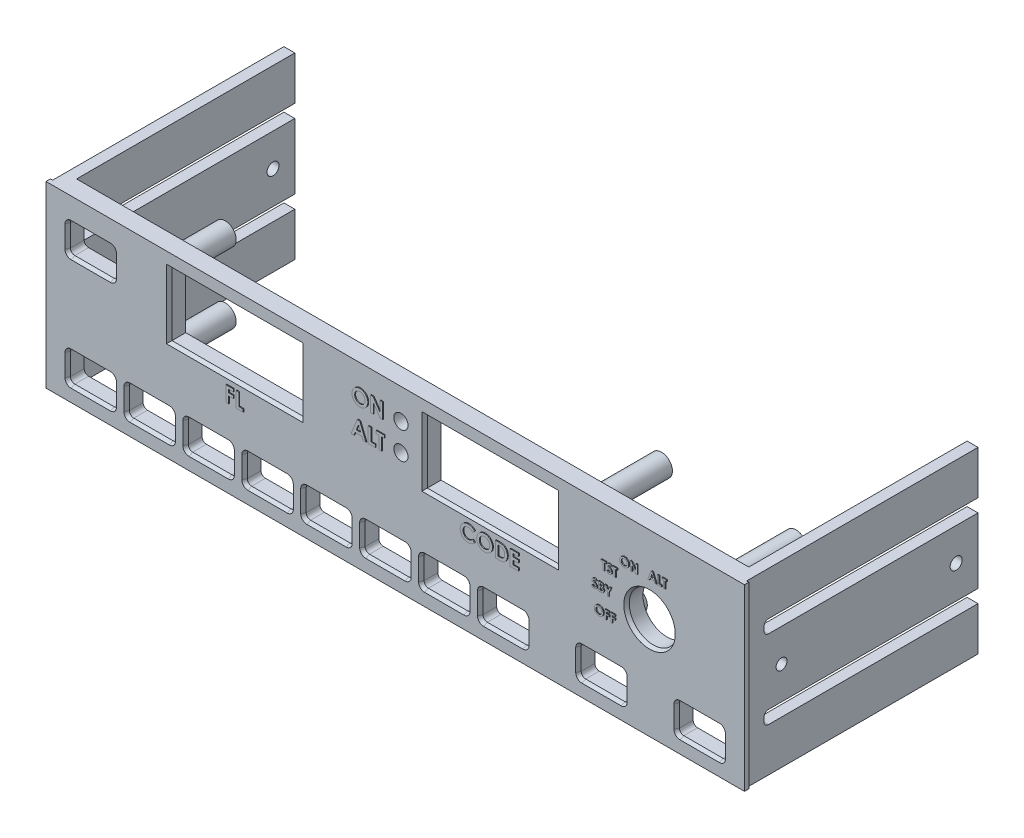
from build123d import *

# Parameters (mm, degrees)
ESQUISSE1_W             = 160
ESQUISSE1_H             = 41
BOSS_EXTRU_1_DEPTH      = 4
ESQUISSE2_R             = 5.5
ESQUISSE2_R_2           = 1.625
ESQUISSE2_W             = 30.5
ESQUISSE2_H             = 15
ENL_V_MAT_EXTRU_1_DEPTH = 4
ESQUISSE4_W             = 3
ESQUISSE4_H             = 41
BOSS_EXTRU_2_DEPTH      = 50
ENL_V_MAT_EXTRU_2_DEPTH = 173.571724219
ESQUISSE7_R             = 2.5
ESQUISSE7_R_2           = 1.25
BOSS_EXTRU_3_DEPTH      = 15
CHANFREIN1_SIZE         = 0.4
CHANFREIN1_SIZE2        = 0.857802768
ESQUISSE9_R             = 1.25
ESQUISSE9_R_2           = 1.375
ENL_V_MAT_EXTRU_3_DEPTH = 900
ENL_V_MAT_EXTRU_4_DEPTH = 0.2
BOSS_EXTRU_4_DEPTH      = 0.2
BOSS_EXTRU_4_2_DEPTH    = 0.2
BOSS_EXTRU_4_3_DEPTH    = 0.2
BOSS_EXTRU_4_4_DEPTH    = 0.2
BOSS_EXTRU_4_5_DEPTH    = 0.2
BOSS_EXTRU_4_6_DEPTH    = 0.2
BOSS_EXTRU_4_7_DEPTH    = 0.2
BOSS_EXTRU_4_8_DEPTH    = 0.2
BOSS_EXTRU_4_9_DEPTH    = 0.2
BOSS_EXTRU_4_10_DEPTH   = 0.2
BOSS_EXTRU_4_11_DEPTH   = 0.2
BOSS_EXTRU_4_12_DEPTH   = 0.2
BOSS_EXTRU_4_13_DEPTH   = 0.2
BOSS_EXTRU_4_14_DEPTH   = 0.2
BOSS_EXTRU_4_15_DEPTH   = 0.2
BOSS_EXTRU_4_16_DEPTH   = 0.2
BOSS_EXTRU_4_17_DEPTH   = 0.2
BOSS_EXTRU_4_18_DEPTH   = 0.2
BOSS_EXTRU_4_19_DEPTH   = 0.2
BOSS_EXTRU_4_20_DEPTH   = 0.2
BOSS_EXTRU_4_21_DEPTH   = 0.2
BOSS_EXTRU_4_22_DEPTH   = 0.2
BOSS_EXTRU_4_23_DEPTH   = 0.2
BOSS_EXTRU_4_24_DEPTH   = 0.2
BOSS_EXTRU_4_25_DEPTH   = 0.2
ENL_V_START             = -1
ESQUISSE10_W            = 4.171279912
ESQUISSE10_H            = 57.921201065
ESQUISSE10_W_2          = 8.342559824
ESQUISSE10_H_2          = 64.595248924
ENL_V_MAT_EXTRU_5_DEPTH = 173.772840341


with BuildPart() as part:
    # Esquisse1 → Boss.-Extru.1 (new body)
    with BuildSketch(Plane.XY):
        with Locations((80, 20.5)):
            Rectangle(ESQUISSE1_W, ESQUISSE1_H)
    extrude(amount=BOSS_EXTRU_1_DEPTH)

    # Esquisse2 → Enlèv. mat.-Extru.1 (cut)
    with BuildSketch(Plane.XY.offset(4)):
        with Locations((138.25, 23.25)):
            Circle(ESQUISSE2_R)
        with Locations((81.3, 34.05)):
            Circle(ESQUISSE2_R_2)
        with Locations((81.3, 27.83)):
            Circle(ESQUISSE2_R_2)
        with BuildLine():
            Line((19.25, 10.25), (28.25, 10.25))
            ThreePointArc((28.25, 10.25), (28.957106781, 9.957106781), (29.25, 9.25))
            Line((29.25, 9.25), (29.25, 4.25))
            ThreePointArc((29.25, 4.25), (28.957106781, 3.542893219), (28.25, 3.25))
            Line((28.25, 3.25), (19.25, 3.25))
            ThreePointArc((19.25, 3.25), (18.542893219, 3.542893219), (18.25, 4.25))
            Line((18.25, 4.25), (18.25, 9.25))
            ThreePointArc((18.25, 9.25), (18.542893219, 9.957106781), (19.25, 10.25))
        make_face()
        with BuildLine():
            Line((5.75, 3.25), (14.75, 3.25))
            ThreePointArc((14.75, 3.25), (15.457106781, 3.542893219), (15.75, 4.25))
            Line((15.75, 4.25), (15.75, 9.25))
            ThreePointArc((15.75, 9.25), (15.457106781, 9.957106781), (14.75, 10.25))
            Line((14.75, 10.25), (5.75, 10.25))
            ThreePointArc((5.75, 10.25), (5.042893219, 9.957106781), (4.75, 9.25))
            Line((4.75, 9.25), (4.75, 4.25))
            ThreePointArc((4.75, 4.25), (5.042893219, 3.542893219), (5.75, 3.25))
        make_face()
        with BuildLine():
            Line((32.75, 10.25), (41.75, 10.25))
            ThreePointArc((41.75, 10.25), (42.457106781, 9.957106781), (42.75, 9.25))
            Line((42.75, 9.25), (42.75, 4.25))
            ThreePointArc((42.75, 4.25), (42.457106781, 3.542893219), (41.75, 3.25))
            Line((41.75, 3.25), (32.75, 3.25))
            ThreePointArc((32.75, 3.25), (32.042893219, 3.542893219), (31.75, 4.25))
            Line((31.75, 4.25), (31.75, 9.25))
            ThreePointArc((31.75, 9.25), (32.042893219, 9.957106781), (32.75, 10.25))
        make_face()
        with BuildLine():
            Line((46.25, 10.25), (55.25, 10.25))
            ThreePointArc((55.25, 10.25), (55.957106781, 9.957106781), (56.25, 9.25))
            Line((56.25, 9.25), (56.25, 4.25))
            ThreePointArc((56.25, 4.25), (55.957106781, 3.542893219), (55.25, 3.25))
            Line((55.25, 3.25), (46.25, 3.25))
            ThreePointArc((46.25, 3.25), (45.542893219, 3.542893219), (45.25, 4.25))
            Line((45.25, 4.25), (45.25, 9.25))
            ThreePointArc((45.25, 9.25), (45.542893219, 9.957106781), (46.25, 10.25))
        make_face()
        with BuildLine():
            Line((59.75, 10.25), (68.75, 10.25))
            ThreePointArc((68.75, 10.25), (69.457106781, 9.957106781), (69.75, 9.25))
            Line((69.75, 9.25), (69.75, 4.25))
            ThreePointArc((69.75, 4.25), (69.457106781, 3.542893219), (68.75, 3.25))
            Line((68.75, 3.25), (59.75, 3.25))
            ThreePointArc((59.75, 3.25), (59.042893219, 3.542893219), (58.75, 4.25))
            Line((58.75, 4.25), (58.75, 9.25))
            ThreePointArc((58.75, 9.25), (59.042893219, 9.957106781), (59.75, 10.25))
        make_face()
        with BuildLine():
            Line((73.25, 10.25), (82.25, 10.25))
            ThreePointArc((82.25, 10.25), (82.957106781, 9.957106781), (83.25, 9.25))
            Line((83.25, 9.25), (83.25, 4.25))
            ThreePointArc((83.25, 4.25), (82.957106781, 3.542893219), (82.25, 3.25))
            Line((82.25, 3.25), (73.25, 3.25))
            ThreePointArc((73.25, 3.25), (72.542893219, 3.542893219), (72.25, 4.25))
            Line((72.25, 4.25), (72.25, 9.25))
            ThreePointArc((72.25, 9.25), (72.542893219, 9.957106781), (73.25, 10.25))
        make_face()
        with BuildLine():
            Line((86.75, 10.25), (95.75, 10.25))
            ThreePointArc((95.75, 10.25), (96.457106781, 9.957106781), (96.75, 9.25))
            Line((96.75, 9.25), (96.75, 4.25))
            ThreePointArc((96.75, 4.25), (96.457106781, 3.542893219), (95.75, 3.25))
            Line((95.75, 3.25), (86.75, 3.25))
            ThreePointArc((86.75, 3.25), (86.042893219, 3.542893219), (85.75, 4.25))
            Line((85.75, 4.25), (85.75, 9.25))
            ThreePointArc((85.75, 9.25), (86.042893219, 9.957106781), (86.75, 10.25))
        make_face()
        with BuildLine():
            Line((100.25, 10.25), (109.25, 10.25))
            ThreePointArc((109.25, 10.25), (109.957106781, 9.957106781), (110.25, 9.25))
            Line((110.25, 9.25), (110.25, 4.25))
            ThreePointArc((110.25, 4.25), (109.957106781, 3.542893219), (109.25, 3.25))
            Line((109.25, 3.25), (100.25, 3.25))
            ThreePointArc((100.25, 3.25), (99.542893219, 3.542893219), (99.25, 4.25))
            Line((99.25, 4.25), (99.25, 9.25))
            ThreePointArc((99.25, 9.25), (99.542893219, 9.957106781), (100.25, 10.25))
        make_face()
        with BuildLine():
            Line((122.75, 3.25), (131.75, 3.25))
            ThreePointArc((131.75, 3.25), (132.457106781, 3.542893219), (132.75, 4.25))
            Line((132.75, 4.25), (132.75, 9.25))
            ThreePointArc((132.75, 9.25), (132.457106781, 9.957106781), (131.75, 10.25))
            Line((131.75, 10.25), (122.75, 10.25))
            ThreePointArc((122.75, 10.25), (122.042893219, 9.957106781), (121.75, 9.25))
            Line((121.75, 9.25), (121.75, 4.25))
            ThreePointArc((121.75, 4.25), (122.042893219, 3.542893219), (122.75, 3.25))
        make_face()
        with BuildLine():
            Line((145.25, 3.25), (154.25, 3.25))
            ThreePointArc((154.25, 3.25), (154.957106781, 3.542893219), (155.25, 4.25))
            Line((155.25, 4.25), (155.25, 9.25))
            ThreePointArc((155.25, 9.25), (154.957106781, 9.957106781), (154.25, 10.25))
            Line((154.25, 10.25), (145.25, 10.25))
            ThreePointArc((145.25, 10.25), (144.542893219, 9.957106781), (144.25, 9.25))
            Line((144.25, 9.25), (144.25, 4.25))
            ThreePointArc((144.25, 4.25), (144.542893219, 3.542893219), (145.25, 3.25))
        make_face()
        with BuildLine():
            Line((5.75, 35.75), (14.75, 35.75))
            ThreePointArc((14.75, 35.75), (15.457106781, 35.457106781), (15.75, 34.75))
            Line((15.75, 34.75), (15.75, 29.75))
            ThreePointArc((15.75, 29.75), (15.457106781, 29.042893219), (14.75, 28.75))
            Line((14.75, 28.75), (5.75, 28.75))
            ThreePointArc((5.75, 28.75), (5.042893219, 29.042893219), (4.75, 29.75))
            Line((4.75, 29.75), (4.75, 34.75))
            ThreePointArc((4.75, 34.75), (5.042893219, 35.457106781), (5.75, 35.75))
        make_face()
        with Locations((43.25, 30.5)):
            Rectangle(ESQUISSE2_W, ESQUISSE2_H)
        with Locations((101.75, 30.5)):
            Rectangle(ESQUISSE2_W, ESQUISSE2_H)
    extrude(amount=-ENL_V_MAT_EXTRU_1_DEPTH, mode=Mode.SUBTRACT)

    # Esquisse4 → Boss.-Extru.2 (add)
    with BuildSketch(Plane(origin=(0, 0, 0), x_dir=(-1, 0, 0), z_dir=(0, 0, -1))):
        with Locations((-158.5, 20.5)):
            Rectangle(ESQUISSE4_W, ESQUISSE4_H)
        with Locations((-1.5, 20.5)):
            Rectangle(ESQUISSE4_W, ESQUISSE4_H)
    extrude(amount=BOSS_EXTRU_2_DEPTH)

    # Esquisse5 → Enlèv. mat.-Extru.2 (cut, through all)
    with BuildSketch(Plane(origin=(160, 0, 0), x_dir=(0, 0, -1), z_dir=(1, 0, 0))):
        with BuildLine():
            Line((50, 13), (2, 13))
            ThreePointArc((2, 13), (1.292893219, 12.707106781), (1, 12))
            Line((1, 12), (1, 11))
            ThreePointArc((1, 11), (1.292893219, 10.292893219), (2, 10))
            Line((2, 10), (50, 10))
            Line((50, 10), (50, 13))
        make_face()
        with BuildLine():
            Line((50, 31), (2, 31))
            ThreePointArc((2, 31), (1.292893219, 30.707106781), (1, 30))
            Line((1, 30), (1, 29))
            ThreePointArc((1, 29), (1.292893219, 28.292893219), (2, 28))
            Line((2, 28), (50, 28))
            Line((50, 28), (50, 31))
        make_face()
    extrude(amount=-ENL_V_MAT_EXTRU_2_DEPTH, mode=Mode.SUBTRACT)

    # Esquisse7 → Boss.-Extru.3 (add)
    # profile 1 of 7: a face of its own
    with BuildSketch(Plane(origin=(0, 0, 0), x_dir=(-1, 0, 0), z_dir=(0, 0, -1))):
        with Locations((-22.066417501, 32.220467417)):
            Circle(ESQUISSE7_R)
        with Locations((-22.066417501, 32.220467417)):
            Circle(ESQUISSE7_R_2, mode=Mode.SUBTRACT)
    # profile 2 of 7: a face of its own
    with BuildSketch(Plane(origin=(0, 0, 0), x_dir=(-1, 0, 0), z_dir=(0, 0, -1))):
        with Locations((-22.066417501, 15.960655172)):
            Circle(ESQUISSE7_R)
        with Locations((-22.066417501, 15.960655172)):
            Circle(ESQUISSE7_R_2, mode=Mode.SUBTRACT)
    # profile 3 of 7: a face of its own
    with BuildSketch(Plane(origin=(0, 0, 0), x_dir=(-1, 0, 0), z_dir=(0, 0, -1))):
        with Locations((-152.81245368, 36.297265299)):
            Circle(ESQUISSE7_R)
        with Locations((-152.81245368, 36.297265299)):
            Circle(ESQUISSE7_R_2, mode=Mode.SUBTRACT)
    # profile 4 of 7: a face of its own
    with BuildSketch(Plane(origin=(0, 0, 0), x_dir=(-1, 0, 0), z_dir=(0, 0, -1))):
        with Locations((-152.81245368, 14.495559759)):
            Circle(ESQUISSE7_R)
        with Locations((-152.81245368, 14.495559759)):
            Circle(ESQUISSE7_R_2, mode=Mode.SUBTRACT)
    # profile 5 of 7: a face of its own
    with BuildSketch(Plane(origin=(0, 0, 0), x_dir=(-1, 0, 0), z_dir=(0, 0, -1))):
        with Locations((-122, 36.297265299)):
            Circle(ESQUISSE7_R)
        with Locations((-122, 36.297265299)):
            Circle(ESQUISSE7_R_2, mode=Mode.SUBTRACT)
    # profile 6 of 7: a face of its own
    with BuildSketch(Plane(origin=(0, 0, 0), x_dir=(-1, 0, 0), z_dir=(0, 0, -1))):
        with Locations((-116.25, 6.75)):
            Circle(ESQUISSE7_R)
        with Locations((-116.25, 6.75)):
            Circle(ESQUISSE7_R_2, mode=Mode.SUBTRACT)
    # profile 7 of 7: a face of its own
    with BuildSketch(Plane(origin=(0, 0, 0), x_dir=(-1, 0, 0), z_dir=(0, 0, -1))):
        with Locations((-63.5, 14.495559759)):
            Circle(ESQUISSE7_R)
        with Locations((-63.5, 14.495559759)):
            Circle(ESQUISSE7_R_2, mode=Mode.SUBTRACT)
    extrude(amount=BOSS_EXTRU_3_DEPTH)

    # Chanfrein1
    chanfrein1_edges = [part.edges().sort_by_distance(p)[0] for p in [
        (101.75, 38, 4),
        (117, 30.5, 4),
        (101.75, 23, 4),
        (86.5, 30.5, 4),
        (58.5, 30.5, 4),
        (43.25, 23, 4),
        (28, 30.5, 4),
        (43.25, 38, 4),
        (132.75, 23.25, 4),
        (149.75, 3.25, 4),
        (154.957106781, 3.542893219, 4),
        (144.542893219, 3.542893219, 4),
        (155.25, 6.75, 4),
        (144.25, 6.75, 4),
        (154.957106781, 9.957106781, 4),
        (144.542893219, 9.957106781, 4),
        (149.75, 10.25, 4),
        (127.25, 3.25, 4),
        (132.457106781, 3.542893219, 4),
        (122.042893219, 3.542893219, 4),
        (132.75, 6.75, 4),
        (121.75, 6.75, 4),
        (132.457106781, 9.957106781, 4),
        (122.042893219, 9.957106781, 4),
        (127.25, 10.25, 4),
        (104.75, 3.25, 4),
        (109.957106781, 3.542893219, 4),
        (99.542893219, 3.542893219, 4),
        (110.25, 6.75, 4),
        (99.25, 6.75, 4),
        (109.957106781, 9.957106781, 4),
        (99.542893219, 9.957106781, 4),
        (104.75, 10.25, 4),
        (91.25, 3.25, 4),
        (96.457106781, 3.542893219, 4),
        (86.042893219, 3.542893219, 4),
        (96.75, 6.75, 4),
        (85.75, 6.75, 4),
        (96.457106781, 9.957106781, 4),
        (86.042893219, 9.957106781, 4),
        (91.25, 10.25, 4),
        (77.75, 3.25, 4),
        (82.957106781, 3.542893219, 4),
        (72.542893219, 3.542893219, 4),
        (83.25, 6.75, 4),
        (72.25, 6.75, 4),
        (82.957106781, 9.957106781, 4),
        (72.542893219, 9.957106781, 4),
        (77.75, 10.25, 4),
        (64.25, 3.25, 4),
        (69.457106781, 3.542893219, 4),
        (59.042893219, 3.542893219, 4),
        (69.75, 6.75, 4),
        (58.75, 6.75, 4),
        (69.457106781, 9.957106781, 4),
        (59.042893219, 9.957106781, 4),
        (64.25, 10.25, 4),
        (50.75, 3.25, 4),
        (55.957106781, 3.542893219, 4),
        (45.542893219, 3.542893219, 4),
        (56.25, 6.75, 4),
        (45.25, 6.75, 4),
        (55.957106781, 9.957106781, 4),
        (45.542893219, 9.957106781, 4),
        (50.75, 10.25, 4),
        (37.25, 3.25, 4),
        (42.457106781, 3.542893219, 4),
        (32.042893219, 3.542893219, 4),
        (42.75, 6.75, 4),
        (31.75, 6.75, 4),
        (42.457106781, 9.957106781, 4),
        (32.042893219, 9.957106781, 4),
        (37.25, 10.25, 4),
        (23.75, 3.25, 4),
        (28.957106781, 3.542893219, 4),
        (18.542893219, 3.542893219, 4),
        (29.25, 6.75, 4),
        (18.25, 6.75, 4),
        (28.957106781, 9.957106781, 4),
        (18.542893219, 9.957106781, 4),
        (23.75, 10.25, 4),
        (10.25, 3.25, 4),
        (15.457106781, 3.542893219, 4),
        (5.042893219, 3.542893219, 4),
        (15.75, 6.75, 4),
        (4.75, 6.75, 4),
        (15.457106781, 9.957106781, 4),
        (5.042893219, 9.957106781, 4),
        (10.25, 10.25, 4),
        (10.25, 35.75, 4),
        (5.042893219, 35.457106781, 4),
        (15.457106781, 35.457106781, 4),
        (4.75, 32.25, 4),
        (15.75, 32.25, 4),
        (5.042893219, 29.042893219, 4),
        (15.457106781, 29.042893219, 4),
        (10.25, 28.75, 4),
    ]]
    chanfrein1_side = [part.faces().sort_by_distance(p)[0] for p in [
        (82.430470131, 20.497923343, 4),
    ]]
    chamfer(chanfrein1_edges, length=CHANFREIN1_SIZE, length2=CHANFREIN1_SIZE2, reference=chanfrein1_side[0])

    # Esquisse9 → Enlèv. mat.-Extru.3 (cut)
    with BuildSketch(Plane(origin=(160, 0, 0), x_dir=(0, 0, -1), z_dir=(1, 0, 0))):
        with Locations((5, 20.5)):
            Circle(ESQUISSE9_R)
        with Locations((45, 20.5)):
            Circle(ESQUISSE9_R_2)
    extrude(amount=-ENL_V_MAT_EXTRU_3_DEPTH, mode=Mode.SUBTRACT)

    # Esquisse8 → Enlèv. mat.-Extru.4 (cut)
    # profile 1 of 25: a face of its own
    with BuildSketch(Plane.XY.offset(4)):
        Polygon((129.575536536, 20.385193728), (130.549895511, 20.385193728), (130.549895511, 20.026219369), (129.934510895, 20.026219369), (129.934510895, 19.641603984), (130.549895511, 19.641603984), (130.549895511, 19.282629625), (129.934510895, 19.282629625), (129.934510895, 18.385193728), (129.575536536, 18.385193728), align=None)
    # profile 2 of 25: a face of its own
    with BuildSketch(Plane.XY.offset(4)):
        Polygon((128.242203203, 20.385193728), (129.216562177, 20.385193728), (129.216562177, 20.026219369), (128.601177562, 20.026219369), (128.601177562, 19.641603984), (129.216562177, 19.641603984), (129.216562177, 19.282629625), (128.601177562, 19.282629625), (128.601177562, 18.385193728), (128.242203203, 18.385193728), align=None)
    # profile 3 of 25: a face of its own
    with BuildSketch(Plane.XY.offset(4)):
        with BuildLine():
            add(Edge.make_bspline(
                [(126.848773716, 20.436475779), (126.883546167, 20.435575458), (126.952194861, 20.433798021), (127.053152318, 20.418981691), (127.150443494, 20.394840605), (127.244024396, 20.36128275), (127.333660706, 20.317399209), (127.419668603, 20.264434108), (127.501740011, 20.201387763), (127.579033926, 20.129730941), (127.650467445, 20.051807276), (127.71236463, 19.967908597), (127.765148279, 19.880208803), (127.808895508, 19.7884729), (127.842217166, 19.692065573), (127.865600352, 19.591478371), (127.88062289, 19.486739912), (127.882350713, 19.415427297), (127.883228844, 19.379184112)],
                knots=[0, 0, 0, 0, 1.014329547, 2.002516266, 2.970391464, 3.935626869, 4.897733899, 5.877609409, 6.878433252, 7.912639331, 8.949961323, 9.958554974, 10.949718813, 11.932905612, 12.9188844, 13.919928257, 14.942845884, 16, 16, 16, 16], degree=3))
            add(Edge.make_bspline(
                [(127.883228844, 19.379184112), (127.882293673, 19.343349305), (127.880450887, 19.272735667), (127.866213638, 19.168962413), (127.842436676, 19.06945271), (127.80968018, 18.973981315), (127.76672636, 18.883010659), (127.714972049, 18.795959906), (127.653051551, 18.713636909), (127.583223349, 18.636085844), (127.506348557, 18.565691613), (127.42492595, 18.503656818), (127.339331485, 18.451090873), (127.249690447, 18.408017858), (127.155810603, 18.374590476), (127.057923849, 18.35100503), (126.956036242, 18.336671678), (126.886747728, 18.334840929), (126.851578203, 18.333911677)],
                knots=[0, 0, 0, 0, 1.051557043, 2.072126891, 3.067553643, 4.050577992, 5.02905126, 6.015227836, 7.017913613, 8.04756643, 9.074058332, 10.072836633, 11.047628519, 12.017157415, 12.98668631, 13.966869689, 14.968021931, 16, 16, 16, 16], degree=3))
            add(Edge.make_bspline(
                [(126.851578203, 18.333911677), (126.814795097, 18.334745262), (126.742521322, 18.336383144), (126.636748328, 18.351958652), (126.535408661, 18.375420808), (126.439353631, 18.410436818), (126.347605001, 18.454209774), (126.260836874, 18.508118794), (126.17907841, 18.572074789), (126.10279859, 18.644439823), (126.033688888, 18.723623041), (125.97268602, 18.807273089), (125.921228748, 18.894750955), (125.879315189, 18.986097579), (125.846272222, 19.080745264), (125.822964163, 19.179270443), (125.809195537, 19.281436817), (125.807277647, 19.35083026), (125.806305767, 19.38599501)],
                knots=[0, 0, 0, 0, 1.067978421, 2.098431617, 3.099715153, 4.085208694, 5.062210972, 6.048429807, 7.046490867, 8.072918869, 9.098532598, 10.095778865, 11.076610158, 12.041847152, 13.011192615, 13.984257998, 14.978533688, 16, 16, 16, 16], degree=3))
            add(Edge.make_bspline(
                [(125.806305767, 19.38599501), (125.806610799, 19.409652013), (125.807217001, 19.456666467), (125.814519337, 19.526339489), (125.825032603, 19.594652587), (125.840581223, 19.661333395), (125.859468823, 19.726852317), (125.883940376, 19.790599485), (125.911795627, 19.853255894), (125.944341864, 19.914081495), (125.980530134, 19.972516641), (126.020014757, 20.028285682), (126.062895019, 20.08071429), (126.109032787, 20.130147004), (126.158587059, 20.176258898), (126.210905999, 20.219702752), (126.26700429, 20.259324542), (126.325654116, 20.296091911), (126.386524823, 20.329340005), (126.449368613, 20.357639788), (126.512890779, 20.382353507), (126.577939891, 20.401858666), (126.643818832, 20.417745415), (126.711231386, 20.428251594), (126.779568519, 20.435553728), (126.825650571, 20.436167699), (126.848773716, 20.436475779)],
                knots=[0, 0, 0, 0, 1.034744296, 2.056386356, 3.06226378, 4.057406941, 5.050368692, 6.043467995, 7.042652155, 8.049140477, 9.059438543, 10.048523776, 11.036952808, 12.020949711, 13.004946614, 13.997082645, 14.994316842, 16.007702937, 17.024872941, 18.026463647, 19.021641123, 20.005082605, 20.995858141, 21.984425357, 22.988620895, 24, 24, 24, 24], degree=3))
        make_face()
        with BuildLine():
            add(Edge.make_bspline(
                [(126.843164741, 20.07750142), (126.819762886, 20.076873496), (126.773576989, 20.075634225), (126.705830689, 20.066192653), (126.640791849, 20.051113391), (126.578821004, 20.029271263), (126.519649567, 20.001471778), (126.463172647, 19.967812071), (126.410172331, 19.927135126), (126.359941911, 19.881624708), (126.314566993, 19.830915643), (126.274476821, 19.776572257), (126.240927804, 19.7186853), (126.212830292, 19.65779253), (126.191679093, 19.593209224), (126.176613728, 19.525441269), (126.16709298, 19.454371898), (126.165892878, 19.405924001), (126.165280126, 19.381187318)],
                knots=[0, 0, 0, 0, 1.033739768, 2.040188636, 3.016340934, 3.979330865, 4.937572243, 5.900995986, 6.878200029, 7.884839167, 8.891893314, 9.879764717, 10.863503415, 11.843163062, 12.837761627, 13.859916423, 14.907309254, 16, 16, 16, 16], degree=3))
            add(Edge.make_bspline(
                [(126.165280126, 19.381187318), (126.166092542, 19.353773508), (126.167684742, 19.300046984), (126.178887654, 19.221672178), (126.198054723, 19.147654953), (126.225731597, 19.078357315), (126.260058183, 19.013009767), (126.302686354, 18.952413234), (126.352925736, 18.896204895), (126.391629749, 18.863388125), (126.411273716, 18.846732189)],
                knots=[0, 0, 0, 0, 1.078454662, 2.113592447, 3.107694534, 4.079536787, 5.043276885, 6.005368276, 6.987637804, 8, 8, 8, 8], degree=3))
            add(Edge.make_bspline(
                [(126.411273716, 18.846732189), (126.427365875, 18.834427424), (126.459187634, 18.810095122), (126.50998209, 18.778908285), (126.562290378, 18.752178054), (126.616507229, 18.730580344), (126.67251814, 18.713591948), (126.730315431, 18.701695254), (126.789817207, 18.69422905), (126.830055096, 18.693336697), (126.85037628, 18.692886036)],
                knots=[0, 0, 0, 0, 1.023928204, 2.024787132, 3.009472467, 3.9914905, 4.972207045, 5.96565515, 6.972602802, 8, 8, 8, 8], degree=3))
            add(Edge.make_bspline(
                [(126.85037628, 18.692886036), (126.873375739, 18.693519284), (126.918627899, 18.69476522), (126.985113065, 18.704090561), (127.048807874, 18.719872403), (127.110107747, 18.741522924), (127.168835925, 18.769671456), (127.224705385, 18.804375181), (127.277814082, 18.845207985), (127.327980509, 18.891316054), (127.373834994, 18.942224878), (127.413841507, 18.996858127), (127.448457214, 19.054012067), (127.475970438, 19.114495626), (127.497957273, 19.177737868), (127.512841318, 19.244018878), (127.522442495, 19.313065421), (127.523642936, 19.360054034), (127.524254485, 19.383991805)],
                knots=[0, 0, 0, 0, 1.026359118, 2.019393844, 2.989460624, 3.950973911, 4.916101784, 5.890408035, 6.881132271, 7.902007068, 8.92769091, 9.933912415, 10.920395702, 11.90457117, 12.894218921, 13.903490204, 14.931958862, 16, 16, 16, 16], degree=3))
            add(Edge.make_bspline(
                [(127.524254485, 19.383991805), (127.523621776, 19.407791927), (127.522376384, 19.454638838), (127.513034631, 19.523507863), (127.497352872, 19.589496262), (127.475637337, 19.652711801), (127.447907749, 19.713216454), (127.4136173, 19.770797452), (127.372886311, 19.825399127), (127.326652204, 19.876649391), (127.27632922, 19.9237451), (127.222302468, 19.964615615), (127.166083678, 20.000130792), (127.106382916, 20.027951949), (127.044421611, 20.050117005), (126.979821669, 20.06643967), (126.912338416, 20.075567897), (126.866428164, 20.076851168), (126.843164741, 20.07750142)],
                knots=[0, 0, 0, 0, 1.055025985, 2.07665775, 3.074803781, 4.057872707, 5.035505728, 6.020516407, 7.023567878, 8.050795229, 9.077271434, 10.074415901, 11.050397877, 12.019801805, 12.988065821, 13.964604439, 14.968634123, 16, 16, 16, 16], degree=3))
        make_face(mode=Mode.SUBTRACT)
    # profile 4 of 25: a face of its own
    with BuildSketch(Plane.XY.offset(4)):
        with BuildLine():
            Line((126.343168247, 24.982772436), (126.07473876, 24.737179487))
            add(Edge.make_bspline(
                [(126.07473876, 24.737179487), (126.063240392, 24.753399131), (126.041165128, 24.784538585), (126.005383429, 24.826235048), (125.969763302, 24.861805234), (125.933974749, 24.891100547), (125.897700554, 24.913942997), (125.861003683, 24.930115703), (125.824092181, 24.940396846), (125.79929335, 24.941677096), (125.787078504, 24.942307692)],
                knots=[0, 0, 0, 0, 1.299362458, 2.494594718, 3.587462134, 4.587049575, 5.512617175, 6.380583204, 7.202344345, 8, 8, 8, 8], degree=3))
            add(Edge.make_bspline(
                [(125.787078504, 24.942307692), (125.775684845, 24.941908118), (125.753686684, 24.941136644), (125.722326673, 24.93346825), (125.694484808, 24.920233729), (125.670188263, 24.902928479), (125.650941815, 24.882079664), (125.635575018, 24.860214619), (125.62692222, 24.836080553), (125.625783342, 24.819504304), (125.625219529, 24.811298077)],
                knots=[0, 0, 0, 0, 1.185010067, 2.2879431, 3.333075148, 4.379039566, 5.372662701, 6.27520591, 7.14612461, 8, 8, 8, 8], degree=3))
            add(Edge.make_bspline(
                [(125.625219529, 24.811298077), (125.625572842, 24.802973513), (125.626284365, 24.786208997), (125.633156704, 24.761638511), (125.643515282, 24.737630287), (125.653413325, 24.723015338), (125.658472734, 24.715544872)],
                knots=[0, 0, 0, 0, 0.967525499, 1.948461899, 2.951351359, 4, 4, 4, 4], degree=3))
            add(Edge.make_bspline(
                [(125.658472734, 24.715544872), (125.663072285, 24.709738157), (125.673659841, 24.696371865), (125.693848144, 24.675201743), (125.719200412, 24.64926649), (125.750692254, 24.619457943), (125.787016357, 24.584704072), (125.82985639, 24.546371064), (125.877979231, 24.503271789), (125.912183831, 24.473259015), (125.93010735, 24.457532051)],
                knots=[0, 0, 0, 0, 0.473873513, 1.090794244, 1.870441696, 2.795289791, 3.865433203, 5.087734844, 6.473946851, 8, 8, 8, 8], degree=3))
            add(Edge.make_bspline(
                [(125.93010735, 24.457532051), (125.94693115, 24.442971901), (125.978859228, 24.41533976), (126.024286542, 24.376120373), (126.064209585, 24.340835647), (126.099209945, 24.310015129), (126.128757051, 24.283335443), (126.152975118, 24.26066906), (126.172159929, 24.242457252), (126.183065371, 24.231457309), (126.187719529, 24.226762821)],
                knots=[0, 0, 0, 0, 1.543621617, 2.929473131, 4.163658386, 5.240097082, 6.164993805, 6.925417477, 7.541396219, 8, 8, 8, 8], degree=3))
            add(Edge.make_bspline(
                [(126.187719529, 24.226762821), (126.205376435, 24.207654267), (126.239319208, 24.170920917), (126.283432847, 24.113995777), (126.319739799, 24.058425234), (126.347827546, 24.003163636), (126.369040542, 23.94741367), (126.383995985, 23.88980807), (126.392952899, 23.829744893), (126.393947326, 23.788759108), (126.394450299, 23.768028846)],
                knots=[0, 0, 0, 0, 1.206664779, 2.319633467, 3.337109185, 4.282041471, 5.190008762, 6.099243693, 7.03861361, 8, 8, 8, 8], degree=3))
            add(Edge.make_bspline(
                [(126.394450299, 23.768028846), (126.394092296, 23.747829748), (126.39338988, 23.708198366), (126.384786642, 23.650203742), (126.372518928, 23.59470037), (126.353550891, 23.542292204), (126.33043276, 23.492118982), (126.301450844, 23.444962242), (126.267415557, 23.400344738), (126.228405893, 23.359064064), (126.185256571, 23.321604713), (126.138974824, 23.288257514), (126.089108083, 23.260725154), (126.036082403, 23.238054219), (125.979926168, 23.220592762), (125.920706275, 23.207687118), (125.858332145, 23.199941354), (125.815679816, 23.199131626), (125.793889401, 23.198717949)],
                knots=[0, 0, 0, 0, 1.043214005, 2.046824704, 3.02475056, 3.976699089, 4.921714032, 5.875962561, 6.831408892, 7.817874052, 8.806269674, 9.781291748, 10.760897367, 11.74438705, 12.757449933, 13.795994037, 14.874007457, 16, 16, 16, 16], degree=3))
            add(Edge.make_bspline(
                [(125.793889401, 23.198717949), (125.776784111, 23.199021408), (125.742905827, 23.199622431), (125.692974357, 23.204529287), (125.644759879, 23.212448429), (125.598316701, 23.223798925), (125.55343559, 23.238181544), (125.510114701, 23.255749362), (125.468653092, 23.276774673), (125.428737047, 23.300825114), (125.390560607, 23.328750844), (125.353641044, 23.359980931), (125.318345079, 23.394995707), (125.284503193, 23.433712363), (125.252331916, 23.476240537), (125.220778167, 23.521987944), (125.191244288, 23.571803594), (125.172999898, 23.606749676), (125.163681068, 23.624599359)],
                knots=[0, 0, 0, 0, 1.016823716, 2.013894106, 2.979844003, 3.91962641, 4.853723003, 5.779685073, 6.695824784, 7.614987388, 8.547259901, 9.504950863, 10.487499108, 11.500346958, 12.559593716, 13.656357062, 14.802919212, 16, 16, 16, 16], degree=3))
            Line((125.163681068, 23.624599359), (125.479386196, 23.814102564))
            add(Edge.make_bspline(
                [(125.479386196, 23.814102564), (125.491042659, 23.793840842), (125.513389095, 23.754997389), (125.551257221, 23.702806287), (125.590051182, 23.658113247), (125.63066786, 23.621708221), (125.672613373, 23.593104429), (125.716090326, 23.572662175), (125.761129265, 23.560008442), (125.791807744, 23.558463129), (125.807110555, 23.557692308)],
                knots=[0, 0, 0, 0, 1.283663364, 2.460892379, 3.537111102, 4.529833553, 5.449777664, 6.316464042, 7.160231139, 8, 8, 8, 8], degree=3))
            add(Edge.make_bspline(
                [(125.807110555, 23.557692308), (125.822675704, 23.558321802), (125.85287436, 23.559543114), (125.895979078, 23.570823998), (125.935499115, 23.588535813), (125.969659943, 23.613808132), (125.998585178, 23.642976228), (126.019933662, 23.675427069), (126.033344924, 23.710538096), (126.034762819, 23.734928525), (126.03547594, 23.747195513)],
                knots=[0, 0, 0, 0, 1.13588714, 2.203786484, 3.234766741, 4.283437687, 5.291419208, 6.222934724, 7.106237994, 8, 8, 8, 8], degree=3))
            add(Edge.make_bspline(
                [(126.03547594, 23.747195513), (126.034817402, 23.758607949), (126.033479647, 23.781791221), (126.023626152, 23.816261017), (126.008222134, 23.850715138), (125.989998095, 23.87897534), (125.971452853, 23.902636841), (125.953719419, 23.923138461), (125.932124787, 23.945789163), (125.906723712, 23.970617438), (125.877851809, 23.997841856), (125.845484756, 24.027459752), (125.809251916, 24.059210227), (125.783642474, 24.080838337), (125.770251581, 24.092147436)],
                knots=[0, 0, 0, 0, 0.916159276, 1.861089862, 2.860218735, 3.940849679, 4.552606315, 5.27541173, 6.11797699, 7.06649574, 8.129236253, 9.306560635, 10.591630461, 12, 12, 12, 12], degree=3))
            add(Edge.make_bspline(
                [(125.770251581, 24.092147436), (125.74479496, 24.113686178), (125.695935999, 24.155025544), (125.626892089, 24.216082486), (125.564677344, 24.273145792), (125.509829118, 24.326920891), (125.461648558, 24.376414681), (125.420461965, 24.422029169), (125.386721793, 24.464116208), (125.351217536, 24.513965489), (125.317481394, 24.574710264), (125.288323794, 24.64779327), (125.269407573, 24.720867003), (125.267288274, 24.769924682), (125.26624517, 24.794070513)],
                knots=[0, 0, 0, 0, 1.345494975, 2.582412109, 3.71882943, 4.751509156, 5.681369928, 6.505683931, 7.230279997, 7.856715994, 8.973648664, 10.023341002, 11.027102913, 12, 12, 12, 12], degree=3))
            add(Edge.make_bspline(
                [(125.26624517, 24.794070513), (125.266678996, 24.81119344), (125.267533678, 24.844927446), (125.27515758, 24.894528386), (125.286551791, 24.942389125), (125.303099456, 24.988335047), (125.324576328, 25.0323086), (125.350659155, 25.074525056), (125.381752953, 25.114595862), (125.416793564, 25.152494455), (125.455399347, 25.187129457), (125.496654532, 25.217698316), (125.54032561, 25.243517218), (125.586145426, 25.264935873), (125.634397904, 25.281330493), (125.684727572, 25.292951816), (125.737206618, 25.299863809), (125.772901732, 25.300803414), (125.791084914, 25.301282051)],
                knots=[0, 0, 0, 0, 1.010766082, 1.991317756, 2.957454644, 3.913069143, 4.869106762, 5.843196583, 6.838735724, 7.860187025, 8.887984031, 9.89767229, 10.887916223, 11.879572884, 12.879850636, 13.892031539, 14.926195476, 16, 16, 16, 16], degree=3))
            add(Edge.make_bspline(
                [(125.791084914, 25.301282051), (125.814649418, 25.300420012), (125.861592417, 25.298702737), (125.930998995, 25.285274208), (125.998792438, 25.264156432), (126.053421665, 25.238680159), (126.096889121, 25.214001281), (126.130202866, 25.191280079), (126.164101394, 25.165251721), (126.198858077, 25.135834185), (126.233827081, 25.102473205), (126.270002742, 25.065962967), (126.306892123, 25.025987936), (126.330864372, 24.997429959), (126.343168247, 24.982772436)],
                knots=[0, 0, 0, 0, 1.282922637, 2.555718331, 3.837320111, 5.142675274, 5.830281639, 6.55870424, 7.337177975, 8.157850921, 9.037902056, 9.96903443, 10.957596896, 12, 12, 12, 12], degree=3))
        make_face()
    # profile 5 of 25: a face of its own
    with BuildSketch(Plane.XY.offset(4)):
        with BuildLine():
            Line((126.753424658, 23.25), (126.753424658, 25.25))
            Line((126.753424658, 25.25), (127.073937478, 25.25))
            add(Edge.make_bspline(
                [(127.073937478, 25.25), (127.09637538, 25.250002561), (127.139792294, 25.250007516), (127.20243157, 25.24780783), (127.260524208, 25.24496229), (127.313885336, 25.241778793), (127.362605777, 25.23629299), (127.406611445, 25.230511554), (127.445990262, 25.223539498), (127.470336044, 25.217285348), (127.481790042, 25.214342949)],
                knots=[0, 0, 0, 0, 1.311965854, 2.538629056, 3.664479157, 4.713267157, 5.663616078, 6.530575999, 7.308677837, 8, 8, 8, 8], degree=3))
            add(Edge.make_bspline(
                [(127.481790042, 25.214342949), (127.496830304, 25.210192642), (127.526344126, 25.202048407), (127.568617338, 25.185600773), (127.608719377, 25.167318062), (127.646601278, 25.146460908), (127.682030432, 25.122777506), (127.714872197, 25.096079899), (127.745834886, 25.067439727), (127.773819088, 25.036058797), (127.799112195, 25.002899031), (127.82108737, 24.967969118), (127.840180981, 24.931803159), (127.85546087, 24.893946031), (127.86697398, 24.854572074), (127.875394621, 24.813849423), (127.880852336, 24.77164922), (127.881368019, 24.742939043), (127.881629786, 24.728365385)],
                knots=[0, 0, 0, 0, 1.099996261, 2.158545794, 3.195537121, 4.207578794, 5.205712374, 6.197378256, 7.190519799, 8.17788031, 9.159561366, 10.129234751, 11.085776129, 12.040971148, 13.00380137, 13.975669004, 14.972423361, 16, 16, 16, 16], degree=3))
            add(Edge.make_bspline(
                [(127.881629786, 24.728365385), (127.880945342, 24.709642059), (127.8795981, 24.672787494), (127.870991823, 24.618654806), (127.854853714, 24.567491635), (127.83373739, 24.518355063), (127.805025791, 24.47142837), (127.768567613, 24.426733869), (127.72495336, 24.382895348), (127.69149882, 24.356617112), (127.674097734, 24.342948718)],
                knots=[0, 0, 0, 0, 0.986156485, 1.941127874, 2.875419072, 3.804401753, 4.751181392, 5.761612777, 6.835722519, 8, 8, 8, 8], degree=3))
            add(Edge.make_bspline(
                [(127.674097734, 24.342948718), (127.688198739, 24.335750277), (127.715846909, 24.321636127), (127.755099187, 24.298436676), (127.791442511, 24.273761118), (127.825039835, 24.248105935), (127.855186416, 24.220383566), (127.883127056, 24.192191413), (127.90748331, 24.161914182), (127.929263407, 24.130631011), (127.948194312, 24.097888916), (127.964681044, 24.063743192), (127.978606794, 24.028077189), (127.99039948, 23.991072419), (127.999194469, 23.952601601), (128.004928988, 23.912650978), (128.009319694, 23.871356802), (128.00966125, 23.84322824), (128.009834914, 23.828926282)],
                knots=[0, 0, 0, 0, 1.164658916, 2.283573913, 3.35186032, 4.395461096, 5.390182219, 6.362969632, 7.312859996, 8.245001507, 9.165155236, 10.092416118, 11.032087915, 11.979892451, 12.947605196, 13.931445124, 14.948243989, 16, 16, 16, 16], degree=3))
            add(Edge.make_bspline(
                [(128.009834914, 23.828926282), (128.008707951, 23.801610361), (128.006483895, 23.7477025), (127.990222684, 23.668553379), (127.962030909, 23.593512834), (127.924175169, 23.522879107), (127.877529615, 23.458696929), (127.823900603, 23.402473899), (127.763828056, 23.354882352), (127.70840387, 23.32276175), (127.660466314, 23.301205822), (127.620760532, 23.287878588), (127.578117364, 23.275532259), (127.531755689, 23.266862412), (127.482515982, 23.258926814), (127.429918151, 23.254027212), (127.374060502, 23.250706872), (127.335695054, 23.250240388), (127.315924658, 23.25)],
                knots=[0, 0, 0, 0, 1.284142165, 2.534249414, 3.780121997, 5.041676246, 6.291546858, 7.49970053, 8.684500223, 9.883330709, 10.50184324, 11.153274765, 11.851151195, 12.587658647, 13.369265475, 14.195992086, 15.070362669, 16, 16, 16, 16], degree=3))
            Line((127.315924658, 23.25), (126.753424658, 23.25))
        make_face()
        with BuildLine():
            Line((127.112399016, 24.891025641), (127.112399016, 24.455128205))
            Line((127.112399016, 24.455128205), (127.207751581, 24.455128205))
            add(Edge.make_bspline(
                [(127.207751581, 24.455128205), (127.220710851, 24.455241215), (127.245727938, 24.455459373), (127.281862466, 24.458269179), (127.315461741, 24.463062881), (127.34639833, 24.469751301), (127.374960417, 24.47824462), (127.400965539, 24.488463912), (127.424299356, 24.500932559), (127.451407856, 24.519505159), (127.480063495, 24.54683557), (127.505288731, 24.586320013), (127.520146227, 24.631726972), (127.521800951, 24.663751475), (127.522655427, 24.680288462)],
                knots=[0, 0, 0, 0, 1.065314748, 2.056525647, 2.977365736, 3.853934255, 4.656397591, 5.425096493, 6.14721249, 6.826394842, 8.123232004, 9.372140726, 10.643011755, 12, 12, 12, 12], degree=3))
            add(Edge.make_bspline(
                [(127.522655427, 24.680288462), (127.52197169, 24.695778097), (127.520649712, 24.725726686), (127.505690124, 24.767777171), (127.482454926, 24.805042507), (127.45502251, 24.830547582), (127.429189559, 24.847966796), (127.407069801, 24.859436607), (127.382791706, 24.869704265), (127.355885275, 24.877555166), (127.32650416, 24.883446205), (127.29479108, 24.887772469), (127.26069132, 24.890717107), (127.237138544, 24.89092059), (127.224979145, 24.891025641)],
                knots=[0, 0, 0, 0, 1.347982417, 2.606269829, 3.849316587, 5.153353503, 5.842674298, 6.568177932, 7.326619318, 8.142485038, 9.012069166, 9.942760135, 10.937925643, 12, 12, 12, 12], degree=3))
            Line((127.224979145, 24.891025641), (127.112399016, 24.891025641))
        make_face(mode=Mode.SUBTRACT)
        with BuildLine():
            Line((127.112399016, 24.121794872), (127.112399016, 23.608974359))
            Line((127.112399016, 23.608974359), (127.215764401, 23.608974359))
            add(Edge.make_bspline(
                [(127.215764401, 23.608974359), (127.236199869, 23.609091106), (127.275489607, 23.609315567), (127.331772086, 23.612027587), (127.382946931, 23.616915526), (127.428878546, 23.623017724), (127.469637285, 23.631285248), (127.505085374, 23.641796345), (127.535708937, 23.653360382), (127.561324354, 23.667643341), (127.582250683, 23.684265164), (127.6011345, 23.701253066), (127.616531188, 23.720850216), (127.628713335, 23.742215362), (127.639256961, 23.764817779), (127.645616132, 23.789540084), (127.650457782, 23.815649566), (127.650724231, 23.83370893), (127.650860555, 23.842948718)],
                knots=[0, 0, 0, 0, 1.753078804, 3.370512758, 4.83203934, 6.162291463, 7.344201807, 8.395507345, 9.331626367, 10.147333109, 10.898971645, 11.62040215, 12.321813352, 13.025280112, 13.727906689, 14.453419512, 15.208716525, 16, 16, 16, 16], degree=3))
            add(Edge.make_bspline(
                [(127.650860555, 23.842948718), (127.650559921, 23.853514561), (127.649974366, 23.874093981), (127.645192131, 23.904173), (127.636501249, 23.93225376), (127.62555466, 23.959054324), (127.610321898, 23.983615139), (127.592218282, 24.00678616), (127.570344492, 24.027782746), (127.545746139, 24.047874848), (127.517054596, 24.065466573), (127.484256401, 24.08073051), (127.447173377, 24.093478388), (127.405690655, 24.103628257), (127.359990092, 24.11224231), (127.309738124, 24.117385851), (127.255353268, 24.121211328), (127.217641923, 24.121595937), (127.198136196, 24.121794872)],
                knots=[0, 0, 0, 0, 0.845221588, 1.646264278, 2.427170338, 3.19324141, 3.95557735, 4.731569926, 5.540061037, 6.376114724, 7.268642756, 8.224665384, 9.265483498, 10.400594375, 11.639216012, 12.983232105, 14.439614077, 16, 16, 16, 16], degree=3))
            Line((127.198136196, 24.121794872), (127.112399016, 24.121794872))
        make_face(mode=Mode.SUBTRACT)
    # profile 6 of 25: a face of its own
    with BuildSketch(Plane.XY.offset(4)):
        Polygon((128.202142606, 25.25), (128.601581709, 25.25), (128.958552863, 24.548477564), (129.315524016, 25.25), (129.714963119, 25.25), (129.138040042, 24.116185897), (129.138040042, 23.25), (128.779065683, 23.25), (128.779065683, 24.116185897), align=None)
    # profile 7 of 25: a face of its own
    with BuildSketch(Plane.XY.offset(4)):
        Polygon((129.970556586, 29.844539257), (131.047479663, 29.844539257), (131.047479663, 29.485564898), (130.688505304, 29.485564898), (130.688505304, 27.844539257), (130.329530945, 27.844539257), (130.329530945, 29.485564898), (129.970556586, 29.485564898), align=None)
    # profile 8 of 25: a face of its own
    with BuildSketch(Plane.XY.offset(4)):
        with BuildLine():
            Line((129.765428381, 29.577311693), (129.496998894, 29.331718744))
            add(Edge.make_bspline(
                [(129.496998894, 29.331718744), (129.485500526, 29.347938388), (129.463425262, 29.379077842), (129.427643563, 29.420774305), (129.392023436, 29.456344491), (129.356234883, 29.485639804), (129.319960688, 29.508482254), (129.283263817, 29.52465496), (129.246352315, 29.534936103), (129.221553484, 29.536216353), (129.209338638, 29.536846949)],
                knots=[0, 0, 0, 0, 1.299362458, 2.494594718, 3.587462134, 4.587049575, 5.512617175, 6.380583204, 7.202344345, 8, 8, 8, 8], degree=3))
            add(Edge.make_bspline(
                [(129.209338638, 29.536846949), (129.197944979, 29.536447375), (129.175946818, 29.535675901), (129.144586807, 29.528007507), (129.116744942, 29.514772986), (129.092448397, 29.497467736), (129.073201948, 29.476618921), (129.057835152, 29.454753876), (129.049182354, 29.43061981), (129.048043476, 29.414043561), (129.047479663, 29.405837334)],
                knots=[0, 0, 0, 0, 1.185010067, 2.2879431, 3.333075148, 4.379039566, 5.372662701, 6.27520591, 7.14612461, 8, 8, 8, 8], degree=3))
            add(Edge.make_bspline(
                [(129.047479663, 29.405837334), (129.047832976, 29.39751277), (129.048544498, 29.380748254), (129.055416838, 29.356177768), (129.065775415, 29.332169544), (129.075673459, 29.317554595), (129.080732868, 29.310084129)],
                knots=[0, 0, 0, 0, 0.967525499, 1.948461899, 2.951351359, 4, 4, 4, 4], degree=3))
            add(Edge.make_bspline(
                [(129.080732868, 29.310084129), (129.085332418, 29.304277414), (129.095919975, 29.290911122), (129.116108278, 29.269741), (129.141460545, 29.243805747), (129.172952387, 29.2139972), (129.209276491, 29.179243329), (129.252116524, 29.140910321), (129.300239365, 29.097811046), (129.334443965, 29.067798272), (129.352367484, 29.052071308)],
                knots=[0, 0, 0, 0, 0.473873513, 1.090794244, 1.870441696, 2.795289791, 3.865433203, 5.087734844, 6.473946851, 8, 8, 8, 8], degree=3))
            add(Edge.make_bspline(
                [(129.352367484, 29.052071308), (129.369191284, 29.037511158), (129.401119362, 29.009879017), (129.446546676, 28.97065963), (129.486469719, 28.935374904), (129.521470079, 28.904554386), (129.551017185, 28.8778747), (129.575235252, 28.855208317), (129.594420063, 28.836996509), (129.605325505, 28.825996566), (129.609979663, 28.821302078)],
                knots=[0, 0, 0, 0, 1.543621617, 2.929473131, 4.163658386, 5.240097082, 6.164993805, 6.925417477, 7.541396219, 8, 8, 8, 8], degree=3))
            add(Edge.make_bspline(
                [(129.609979663, 28.821302078), (129.627636569, 28.802193524), (129.661579342, 28.765460174), (129.705692981, 28.708535034), (129.741999933, 28.652964491), (129.77008768, 28.597702893), (129.791300676, 28.541952927), (129.806256119, 28.484347327), (129.815213033, 28.42428415), (129.81620746, 28.383298365), (129.816710432, 28.362568103)],
                knots=[0, 0, 0, 0, 1.206664779, 2.319633467, 3.337109185, 4.282041471, 5.190008762, 6.099243693, 7.03861361, 8, 8, 8, 8], degree=3))
            add(Edge.make_bspline(
                [(129.816710432, 28.362568103), (129.816352429, 28.342369005), (129.815650014, 28.302737623), (129.807046776, 28.244742999), (129.794779062, 28.189239627), (129.775811025, 28.136831461), (129.752692894, 28.086658239), (129.723710978, 28.039501499), (129.689675691, 27.994883995), (129.650666027, 27.953603321), (129.607516705, 27.91614397), (129.561234958, 27.882796771), (129.511368217, 27.855264411), (129.458342537, 27.832593476), (129.402186302, 27.815132019), (129.342966409, 27.802226375), (129.280592279, 27.794480611), (129.23793995, 27.793670883), (129.216149535, 27.793257206)],
                knots=[0, 0, 0, 0, 1.043214005, 2.046824704, 3.02475056, 3.976699089, 4.921714032, 5.875962561, 6.831408892, 7.817874052, 8.806269674, 9.781291748, 10.760897367, 11.74438705, 12.757449933, 13.795994037, 14.874007457, 16, 16, 16, 16], degree=3))
            add(Edge.make_bspline(
                [(129.216149535, 27.793257206), (129.199044245, 27.793560665), (129.16516596, 27.794161688), (129.115234491, 27.799068544), (129.067020013, 27.806987686), (129.020576835, 27.818338182), (128.975695724, 27.832720801), (128.932374834, 27.850288619), (128.890913226, 27.87131393), (128.850997181, 27.895364371), (128.81282074, 27.923290101), (128.775901178, 27.954520188), (128.740605213, 27.989534964), (128.706763327, 28.02825162), (128.67459205, 28.070779794), (128.643038301, 28.116527201), (128.613504422, 28.166342851), (128.595260031, 28.201288933), (128.585941202, 28.219138616)],
                knots=[0, 0, 0, 0, 1.016823716, 2.013894106, 2.979844003, 3.91962641, 4.853723003, 5.779685073, 6.695824784, 7.614987388, 8.547259901, 9.504950863, 10.487499108, 11.500346958, 12.559593716, 13.656357062, 14.802919212, 16, 16, 16, 16], degree=3))
            Line((128.585941202, 28.219138616), (128.90164633, 28.408641821))
            add(Edge.make_bspline(
                [(128.90164633, 28.408641821), (128.913302793, 28.388380099), (128.935649229, 28.349536646), (128.973517355, 28.297345544), (129.012311316, 28.252652504), (129.052927994, 28.216247478), (129.094873507, 28.187643686), (129.13835046, 28.167201432), (129.183389399, 28.154547699), (129.214067878, 28.153002386), (129.229370689, 28.152231565)],
                knots=[0, 0, 0, 0, 1.283663364, 2.460892379, 3.537111102, 4.529833553, 5.449777664, 6.316464042, 7.160231139, 8, 8, 8, 8], degree=3))
            add(Edge.make_bspline(
                [(129.229370689, 28.152231565), (129.244935838, 28.152861059), (129.275134494, 28.154082371), (129.318239212, 28.165363255), (129.357759249, 28.18307507), (129.391920077, 28.208347389), (129.420845312, 28.237515485), (129.442193796, 28.269966326), (129.455605058, 28.305077353), (129.457022953, 28.329467782), (129.457736073, 28.34173477)],
                knots=[0, 0, 0, 0, 1.13588714, 2.203786484, 3.234766741, 4.283437687, 5.291419208, 6.222934724, 7.106237994, 8, 8, 8, 8], degree=3))
            add(Edge.make_bspline(
                [(129.457736073, 28.34173477), (129.457077536, 28.353147206), (129.455739781, 28.376330478), (129.445886286, 28.410800274), (129.430482268, 28.445254395), (129.412258229, 28.473514597), (129.393712987, 28.497176098), (129.375979553, 28.517677718), (129.354384921, 28.54032842), (129.328983846, 28.565156695), (129.300111943, 28.592381113), (129.26774489, 28.621999009), (129.23151205, 28.653749484), (129.205902608, 28.675377594), (129.192511715, 28.686686693)],
                knots=[0, 0, 0, 0, 0.916159276, 1.861089862, 2.860218735, 3.940849679, 4.552606315, 5.27541173, 6.11797699, 7.06649574, 8.129236253, 9.306560635, 10.591630461, 12, 12, 12, 12], degree=3))
            add(Edge.make_bspline(
                [(129.192511715, 28.686686693), (129.167055094, 28.708225435), (129.118196133, 28.749564801), (129.049152223, 28.810621743), (128.986937478, 28.867685049), (128.932089252, 28.921460148), (128.883908692, 28.970953938), (128.842722099, 29.016568426), (128.808981927, 29.058655465), (128.77347767, 29.108504746), (128.739741528, 29.169249521), (128.710583928, 29.242332527), (128.691667707, 29.31540626), (128.689548408, 29.364463939), (128.688505304, 29.38860977)],
                knots=[0, 0, 0, 0, 1.345494975, 2.582412109, 3.71882943, 4.751509156, 5.681369928, 6.505683931, 7.230279997, 7.856715994, 8.973648664, 10.023341002, 11.027102913, 12, 12, 12, 12], degree=3))
            add(Edge.make_bspline(
                [(128.688505304, 29.38860977), (128.68893913, 29.405732697), (128.689793812, 29.439466703), (128.697417714, 29.489067643), (128.708811925, 29.536928382), (128.72535959, 29.582874304), (128.746836462, 29.626847857), (128.772919289, 29.669064313), (128.804013087, 29.709135119), (128.839053698, 29.747033712), (128.877659481, 29.781668714), (128.918914665, 29.812237573), (128.962585744, 29.838056475), (129.00840556, 29.85947513), (129.056658038, 29.87586975), (129.106987706, 29.887491073), (129.159466752, 29.894403066), (129.195161866, 29.895342671), (129.213345048, 29.895821308)],
                knots=[0, 0, 0, 0, 1.010766082, 1.991317756, 2.957454644, 3.913069143, 4.869106762, 5.843196583, 6.838735724, 7.860187025, 8.887984031, 9.89767229, 10.887916223, 11.879572884, 12.879850636, 13.892031539, 14.926195476, 16, 16, 16, 16], degree=3))
            add(Edge.make_bspline(
                [(129.213345048, 29.895821308), (129.236909552, 29.894959269), (129.283852551, 29.893241994), (129.353259129, 29.879813465), (129.421052572, 29.858695689), (129.475681799, 29.833219416), (129.519149255, 29.808540538), (129.552463, 29.785819336), (129.586361528, 29.759790978), (129.621118211, 29.730373442), (129.656087215, 29.697012462), (129.692262876, 29.660502224), (129.729152257, 29.620527193), (129.753124506, 29.591969216), (129.765428381, 29.577311693)],
                knots=[0, 0, 0, 0, 1.282922637, 2.555718331, 3.837320111, 5.142675274, 5.830281639, 6.55870424, 7.337177975, 8.157850921, 9.037902056, 9.96903443, 10.957596896, 12, 12, 12, 12], degree=3))
        make_face()
    # profile 9 of 25: a face of its own
    with BuildSketch(Plane.XY.offset(4)):
        Polygon((127.380812997, 29.844539257), (128.457736073, 29.844539257), (128.457736073, 29.485564898), (128.098761715, 29.485564898), (128.098761715, 27.844539257), (127.739787356, 27.844539257), (127.739787356, 29.485564898), (127.380812997, 29.485564898), align=None)
    # profile 10 of 25: a face of its own
    with BuildSketch(Plane.XY.offset(4)):
        Polygon((134.053154527, 32.888916358), (134.376471835, 32.888916358), (135.283923758, 31.572810589), (135.283923758, 32.888916358), (135.642898117, 32.888916358), (135.642898117, 30.888916358), (135.317176963, 30.888916358), (134.412128886, 32.201015717), (134.412128886, 30.888916358), (134.053154527, 30.888916358), align=None)
    # profile 11 of 25: a face of its own
    with BuildSketch(Plane.XY.offset(4)):
        with BuildLine():
            add(Edge.make_bspline(
                [(132.65972504, 32.940198409), (132.694497491, 32.939298088), (132.763146185, 32.937520651), (132.864103642, 32.922704321), (132.961394818, 32.898563235), (133.05497572, 32.86500538), (133.14461203, 32.821121839), (133.230619927, 32.768156738), (133.312691335, 32.705110393), (133.38998525, 32.633453571), (133.461418769, 32.555529906), (133.523315954, 32.471631227), (133.576099603, 32.383931433), (133.619846832, 32.29219553), (133.65316849, 32.195788203), (133.676551676, 32.095201002), (133.691574214, 31.990462542), (133.693302037, 31.919149927), (133.694180168, 31.882906743)],
                knots=[0, 0, 0, 0, 1.014329547, 2.002516266, 2.970391464, 3.935626869, 4.897733899, 5.877609409, 6.878433252, 7.912639331, 8.949961323, 9.958554974, 10.949718813, 11.932905612, 12.9188844, 13.919928257, 14.942845884, 16, 16, 16, 16], degree=3))
            add(Edge.make_bspline(
                [(133.694180168, 31.882906743), (133.693244997, 31.847071935), (133.691402211, 31.776458297), (133.677164961, 31.672685043), (133.653388, 31.57317534), (133.620631504, 31.477703945), (133.577677684, 31.386733289), (133.525923373, 31.299682536), (133.464002875, 31.217359539), (133.394174672, 31.139808474), (133.317299881, 31.069414243), (133.235877274, 31.007379448), (133.150282809, 30.954813503), (133.06064177, 30.911740488), (132.966761927, 30.878313106), (132.868875173, 30.85472766), (132.766987566, 30.840394308), (132.697699052, 30.83856356), (132.662529527, 30.837634307)],
                knots=[0, 0, 0, 0, 1.051557043, 2.072126891, 3.067553643, 4.050577992, 5.02905126, 6.015227836, 7.017913613, 8.04756643, 9.074058332, 10.072836633, 11.047628519, 12.017157415, 12.98668631, 13.966869689, 14.968021931, 16, 16, 16, 16], degree=3))
            add(Edge.make_bspline(
                [(132.662529527, 30.837634307), (132.625746421, 30.838467892), (132.553472646, 30.840105774), (132.447699652, 30.855681282), (132.346359985, 30.879143439), (132.250304955, 30.914159448), (132.158556325, 30.957932404), (132.071788198, 31.011841425), (131.990029734, 31.07579742), (131.913749914, 31.148162453), (131.844640212, 31.227345671), (131.783637344, 31.310995719), (131.732180072, 31.398473585), (131.690266512, 31.489820209), (131.657223546, 31.584467895), (131.633915487, 31.682993074), (131.620146861, 31.785159447), (131.618228971, 31.85455289), (131.617257091, 31.88971764)],
                knots=[0, 0, 0, 0, 1.067978421, 2.098431617, 3.099715153, 4.085208694, 5.062210972, 6.048429807, 7.046490867, 8.072918869, 9.098532598, 10.095778865, 11.076610158, 12.041847152, 13.011192615, 13.984257998, 14.978533688, 16, 16, 16, 16], degree=3))
            add(Edge.make_bspline(
                [(131.617257091, 31.88971764), (131.617562123, 31.913374643), (131.618168325, 31.960389098), (131.625470661, 32.030062119), (131.635983926, 32.098375217), (131.651532547, 32.165056025), (131.670420147, 32.230574947), (131.6948917, 32.294322115), (131.722746951, 32.356978525), (131.755293188, 32.417804125), (131.791481458, 32.476239271), (131.830966081, 32.532008312), (131.873846343, 32.58443692), (131.919984111, 32.633869634), (131.969538383, 32.679981528), (132.021857323, 32.723425382), (132.077955613, 32.763047172), (132.13660544, 32.799814541), (132.197476147, 32.833062635), (132.260319937, 32.861362418), (132.323842102, 32.886076137), (132.388891214, 32.905581296), (132.454770156, 32.921468045), (132.52218271, 32.931974224), (132.590519843, 32.939276358), (132.636601895, 32.93989033), (132.65972504, 32.940198409)],
                knots=[0, 0, 0, 0, 1.034744296, 2.056386356, 3.06226378, 4.057406941, 5.050368692, 6.043467995, 7.042652155, 8.049140477, 9.059438543, 10.048523776, 11.036952808, 12.020949711, 13.004946614, 13.997082645, 14.994316842, 16.007702937, 17.024872941, 18.026463647, 19.021641123, 20.005082605, 20.995858141, 21.984425357, 22.988620895, 24, 24, 24, 24], degree=3))
        make_face()
        with BuildLine():
            add(Edge.make_bspline(
                [(132.654116065, 32.58122405), (132.63071421, 32.580596126), (132.584528313, 32.579356855), (132.516782013, 32.569915283), (132.451743173, 32.554836021), (132.389772328, 32.532993893), (132.330600891, 32.505194408), (132.274123971, 32.471534701), (132.221123655, 32.430857756), (132.170893235, 32.385347338), (132.125518317, 32.334638273), (132.085428145, 32.280294887), (132.051879128, 32.22240793), (132.023781616, 32.16151516), (132.002630417, 32.096931854), (131.987565052, 32.029163899), (131.978044304, 31.958094528), (131.976844202, 31.909646631), (131.97623145, 31.884909948)],
                knots=[0, 0, 0, 0, 1.033739768, 2.040188636, 3.016340934, 3.979330865, 4.937572243, 5.900995986, 6.878200029, 7.884839167, 8.891893314, 9.879764717, 10.863503415, 11.843163062, 12.837761627, 13.859916423, 14.907309254, 16, 16, 16, 16], degree=3))
            add(Edge.make_bspline(
                [(131.97623145, 31.884909948), (131.977043866, 31.857496138), (131.978636066, 31.803769614), (131.989838978, 31.725394808), (132.009006047, 31.651377583), (132.036682921, 31.582079945), (132.071009507, 31.516732397), (132.113637678, 31.456135865), (132.16387706, 31.399927525), (132.202581073, 31.367110755), (132.22222504, 31.35045482)],
                knots=[0, 0, 0, 0, 1.078454662, 2.113592447, 3.107694534, 4.079536787, 5.043276885, 6.005368276, 6.987637804, 8, 8, 8, 8], degree=3))
            add(Edge.make_bspline(
                [(132.22222504, 31.35045482), (132.238317199, 31.338150054), (132.270138958, 31.313817752), (132.320933414, 31.282630915), (132.373241702, 31.255900684), (132.427458553, 31.234302974), (132.483469464, 31.217314579), (132.541266755, 31.205417884), (132.600768531, 31.19795168), (132.64100642, 31.197059327), (132.661327604, 31.196608666)],
                knots=[0, 0, 0, 0, 1.023928204, 2.024787132, 3.009472467, 3.9914905, 4.972207045, 5.96565515, 6.972602802, 8, 8, 8, 8], degree=3))
            add(Edge.make_bspline(
                [(132.661327604, 31.196608666), (132.684327063, 31.197241914), (132.729579223, 31.19848785), (132.796064389, 31.207813191), (132.859759198, 31.223595034), (132.921059071, 31.245245554), (132.979787248, 31.273394086), (133.035656709, 31.308097812), (133.088765406, 31.348930615), (133.138931833, 31.395038684), (133.184786318, 31.445947508), (133.22479283, 31.500580757), (133.259408538, 31.557734697), (133.286921762, 31.618218256), (133.308908597, 31.681460498), (133.323792642, 31.747741508), (133.333393819, 31.816788051), (133.334594259, 31.863776664), (133.335205809, 31.887714435)],
                knots=[0, 0, 0, 0, 1.026359118, 2.019393844, 2.989460624, 3.950973911, 4.916101784, 5.890408035, 6.881132271, 7.902007068, 8.92769091, 9.933912415, 10.920395702, 11.90457117, 12.894218921, 13.903490204, 14.931958862, 16, 16, 16, 16], degree=3))
            add(Edge.make_bspline(
                [(133.335205809, 31.887714435), (133.3345731, 31.911514557), (133.333327708, 31.958361468), (133.323985954, 32.027230493), (133.308304196, 32.093218892), (133.286588661, 32.156434431), (133.258859073, 32.216939084), (133.224568624, 32.274520082), (133.183837635, 32.329121757), (133.137603528, 32.380372021), (133.087280544, 32.42746773), (133.033253792, 32.468338245), (132.977035002, 32.503853423), (132.91733424, 32.531674579), (132.855372934, 32.553839635), (132.790772993, 32.5701623), (132.72328974, 32.579290527), (132.677379488, 32.580573798), (132.654116065, 32.58122405)],
                knots=[0, 0, 0, 0, 1.055025985, 2.07665775, 3.074803781, 4.057872707, 5.035505728, 6.020516407, 7.023567878, 8.050795229, 9.077271434, 10.074415901, 11.050397877, 12.019801805, 12.988065821, 13.964604439, 14.968634123, 16, 16, 16, 16], degree=3))
        make_face(mode=Mode.SUBTRACT)
    # profile 12 of 25: a face of its own
    with BuildSketch(Plane.XY.offset(4)):
        Polygon((141.308154574, 33.217081802), (142.385077651, 33.217081802), (142.385077651, 32.858107443), (142.026103292, 32.858107443), (142.026103292, 31.217081802), (141.667128933, 31.217081802), (141.667128933, 32.858107443), (141.308154574, 32.858107443), align=None)
    # profile 13 of 25: a face of its own
    with BuildSketch(Plane.XY.offset(4)):
        Polygon((140.282513549, 33.217081802), (140.641487908, 33.217081802), (140.641487908, 31.576056161), (141.205590472, 31.576056161), (141.205590472, 31.217081802), (140.282513549, 31.217081802), align=None)
    # profile 14 of 25: a face of its own
    with BuildSketch(Plane.XY.offset(4)):
        Polygon((138.847016754, 33.217081802), (139.179949446, 33.217081802), (139.987641754, 31.217081802), (139.604228292, 31.217081802), (139.448779574, 31.627338212), (138.577385344, 31.627338212), (138.421936626, 31.217081802), (138.038923805, 31.217081802), align=None)
        Polygon((139.01328278, 32.680623469), (138.713603292, 31.986312571), (139.312962267, 31.986312571), align=None, mode=Mode.SUBTRACT)
    # profile 15 of 25: a face of its own
    with BuildSketch(Plane.XY.offset(4)):
        with BuildLine():
            Line((98.407051282, 20.892828526), (97.946414263, 20.452524038))
            add(Edge.make_bspline(
                [(97.946414263, 20.452524038), (97.907339278, 20.492927638), (97.831013591, 20.571848526), (97.708024186, 20.676332827), (97.580119683, 20.763406355), (97.449788209, 20.836739125), (97.314685478, 20.892220593), (97.176373645, 20.932650872), (97.03396955, 20.957299686), (96.937595936, 20.960119946), (96.889122596, 20.961538462)],
                knots=[0, 0, 0, 0, 1.115251505, 2.178435587, 3.19620269, 4.182487026, 5.141301733, 6.088180966, 7.038406374, 8, 8, 8, 8], degree=3))
            add(Edge.make_bspline(
                [(96.889122596, 20.961538462), (96.848641467, 20.960417785), (96.768756419, 20.958206253), (96.651464234, 20.941993543), (96.539268197, 20.914423124), (96.431784244, 20.876425979), (96.32932865, 20.82725969), (96.231686605, 20.766962311), (96.139098841, 20.696078413), (96.052788389, 20.614974752), (95.973834621, 20.526362907), (95.90407394, 20.431814281), (95.845638179, 20.331545478), (95.7976809, 20.226571947), (95.760324034, 20.116407818), (95.733646538, 20.00112726), (95.718216988, 19.88059298), (95.715914024, 19.798654675), (95.71474359, 19.757011218)],
                knots=[0, 0, 0, 0, 1.035432265, 2.043311493, 3.022114605, 3.98653278, 4.95457646, 5.923598177, 6.917315552, 7.932509744, 8.948865224, 9.949768934, 10.933144597, 11.912367597, 12.897413939, 13.903909035, 14.934704909, 16, 16, 16, 16], degree=3))
            add(Edge.make_bspline(
                [(95.71474359, 19.757011218), (95.715080895, 19.727782926), (95.715745732, 19.670173362), (95.723023543, 19.584952828), (95.734742536, 19.502268764), (95.751702821, 19.422246412), (95.772911825, 19.344816425), (95.797794815, 19.26931082), (95.82901016, 19.196772912), (95.863659665, 19.126360221), (95.903956639, 19.059994047), (95.947404211, 18.996708391), (95.99451601, 18.936813475), (96.045597181, 18.88055415), (96.101366627, 18.828809624), (96.160382916, 18.780023877), (96.223641571, 18.735418182), (96.289828548, 18.69387311), (96.35951562, 18.657782552), (96.430812015, 18.625091479), (96.50479873, 18.598541467), (96.580574932, 18.577139735), (96.657869823, 18.558940759), (96.73743942, 18.54773509), (96.818593955, 18.539249168), (96.873440798, 18.538725212), (96.901041667, 18.538461538)],
                knots=[0, 0, 0, 0, 1.103660481, 2.175337485, 3.227646561, 4.255952547, 5.262355991, 6.258840057, 7.255597736, 8.242457506, 9.22035537, 10.185017736, 11.140346927, 12.096287581, 13.051739095, 14.01125915, 14.986044842, 15.97314143, 16.960198552, 17.947847494, 18.933482797, 19.925264591, 20.920966487, 21.929612487, 22.958107872, 24, 24, 24, 24], degree=3))
            add(Edge.make_bspline(
                [(96.901041667, 18.538461538), (96.947857484, 18.5398157), (97.03983839, 18.542476276), (97.174833596, 18.563281603), (97.303470578, 18.597505189), (97.406250911, 18.637921255), (97.486776587, 18.677832645), (97.548079594, 18.714748715), (97.611471681, 18.756043392), (97.67589996, 18.803275183), (97.742089121, 18.855877287), (97.808870773, 18.915001788), (97.877954538, 18.978701801), (97.923210628, 19.024165752), (97.946414263, 19.047475962)],
                knots=[0, 0, 0, 0, 1.404581149, 2.759636711, 4.088442092, 5.392261763, 6.066678138, 6.783632037, 7.538459478, 8.336747902, 9.180226004, 10.074962426, 11.012997595, 12, 12, 12, 12], degree=3))
            Line((97.946414263, 19.047475962), (98.393028846, 18.578425481))
            add(Edge.make_bspline(
                [(98.393028846, 18.578425481), (98.361634245, 18.548114979), (98.300358697, 18.488955361), (98.207926234, 18.404954225), (98.115610102, 18.329469865), (98.025640464, 18.259762532), (97.936543526, 18.197862968), (97.848328735, 18.143709355), (97.761994721, 18.095932068), (97.675748731, 18.055336849), (97.589054099, 18.020867291), (97.49985551, 17.991191265), (97.407880276, 17.966086414), (97.312566654, 17.945830096), (97.214803672, 17.929587264), (97.113676399, 17.918623446), (97.00982603, 17.911252837), (96.939382717, 17.910590526), (96.903846154, 17.91025641)],
                knots=[0, 0, 0, 0, 1.244526981, 2.429050516, 3.560637417, 4.644440555, 5.67424972, 6.652764056, 7.595344123, 8.486817594, 9.369275933, 10.254498637, 11.166417451, 12.086725134, 13.032340136, 13.991389299, 14.986715468, 16, 16, 16, 16], degree=3))
            add(Edge.make_bspline(
                [(96.903846154, 17.91025641), (96.83856989, 17.911920432), (96.710842386, 17.915176461), (96.523661059, 17.93930143), (96.345843824, 17.979746515), (96.176958083, 18.036947022), (96.017057538, 18.110017988), (95.866183098, 18.199599561), (95.724577938, 18.305453737), (95.593385949, 18.426339803), (95.474716551, 18.559848314), (95.369826546, 18.703199828), (95.28306153, 18.857098866), (95.211018667, 19.019271846), (95.154682096, 19.190458828), (95.115030701, 19.370844982), (95.090577975, 19.560256136), (95.087902812, 19.689628321), (95.086538462, 19.755608974)],
                knots=[0, 0, 0, 0, 1.078019885, 2.10938526, 3.111377082, 4.085535484, 5.04941344, 6.010039228, 6.978205633, 7.964457913, 8.951525778, 9.924444315, 10.892603023, 11.863865945, 12.85144698, 13.863884204, 14.910567087, 16, 16, 16, 16], degree=3))
            add(Edge.make_bspline(
                [(95.086538462, 19.755608974), (95.08711497, 19.798640994), (95.088257469, 19.883919938), (95.100265236, 20.009542733), (95.117004762, 20.132002487), (95.143560498, 20.250027663), (95.175570818, 20.365208277), (95.215379857, 20.476292451), (95.262924034, 20.583599451), (95.316670889, 20.687308917), (95.377474167, 20.78674144), (95.445398104, 20.881042737), (95.518694073, 20.970940799), (95.599123256, 21.055242959), (95.685516912, 21.134689407), (95.778265099, 21.208849608), (95.876809981, 21.278787103), (95.981418284, 21.342698373), (96.090057748, 21.400509514), (96.201358142, 21.451501409), (96.315046014, 21.494118891), (96.430640682, 21.529468521), (96.548630532, 21.555854519), (96.668173382, 21.575827869), (96.790286398, 21.586993099), (96.872274709, 21.588820919), (96.913661859, 21.58974359)],
                knots=[0, 0, 0, 0, 1.071919942, 2.124283339, 3.142214191, 4.149696895, 5.136002878, 6.119640489, 7.086990633, 8.058538607, 9.028339693, 9.988281803, 10.952401235, 11.916291999, 12.888973767, 13.874849856, 14.873389453, 15.898127285, 16.927174885, 17.938320013, 18.946391617, 19.950418109, 20.947802303, 21.956882652, 22.968648068, 24, 24, 24, 24], degree=3))
            add(Edge.make_bspline(
                [(96.913661859, 21.58974359), (96.948969341, 21.589214692), (97.019217206, 21.588162395), (97.123828065, 21.579390354), (97.227602295, 21.565613953), (97.330168353, 21.544828298), (97.432259897, 21.520153099), (97.532535327, 21.487844329), (97.632576545, 21.451830117), (97.730814552, 21.408782479), (97.827386473, 21.361792095), (97.92002996, 21.308479797), (98.010300488, 21.252126365), (98.096197717, 21.189396556), (98.179330686, 21.122565697), (98.259264685, 21.051321984), (98.335298248, 20.974477576), (98.38301269, 20.920182466), (98.407051282, 20.892828526)],
                knots=[0, 0, 0, 0, 0.996412454, 1.982464992, 2.961075852, 3.949442424, 4.934965278, 5.923860011, 6.921385422, 7.934793307, 8.949617135, 9.951082467, 10.950285876, 11.951772932, 12.951063433, 13.960125323, 14.972308753, 16, 16, 16, 16], degree=3))
        make_face()
    # profile 16 of 25: a face of its own
    with BuildSketch(Plane.XY.offset(4)):
        with BuildLine():
            add(Edge.make_bspline(
                [(100.680088141, 21.58974359), (100.74093993, 21.588168028), (100.861075146, 21.585057512), (101.037750695, 21.559128935), (101.208010253, 21.516882035), (101.371776831, 21.458155789), (101.528640374, 21.381359592), (101.679154194, 21.288670665), (101.822779157, 21.178339561), (101.95804351, 21.052940123), (102.083052167, 20.91657371), (102.191372241, 20.769751021), (102.283743626, 20.616276382), (102.360301278, 20.455738551), (102.418614179, 20.287025729), (102.459534754, 20.110998126), (102.485824196, 19.927705822), (102.488847886, 19.802908746), (102.490384615, 19.739483173)],
                knots=[0, 0, 0, 0, 1.014329547, 2.002516266, 2.970391464, 3.935626869, 4.897733899, 5.877609409, 6.878433252, 7.912639331, 8.949961323, 9.958554974, 10.949718813, 11.932905612, 12.9188844, 13.919928257, 14.942845884, 16, 16, 16, 16], degree=3))
            add(Edge.make_bspline(
                [(102.490384615, 19.739483173), (102.488748065, 19.67677226), (102.485523191, 19.553198393), (102.460608004, 19.371595199), (102.418998322, 19.197453219), (102.361674453, 19.030378278), (102.286505268, 18.871179629), (102.195935225, 18.718840812), (102.087574353, 18.574775566), (101.965374998, 18.439061204), (101.830844114, 18.315871298), (101.688354551, 18.207310407), (101.538564238, 18.115320004), (101.38169242, 18.039942227), (101.217402693, 17.98144431), (101.046100874, 17.940169778), (100.867797561, 17.915086412), (100.746542662, 17.911882603), (100.684995994, 17.91025641)],
                knots=[0, 0, 0, 0, 1.051557043, 2.072126891, 3.067553643, 4.050577992, 5.02905126, 6.015227836, 7.017913613, 8.04756643, 9.074058332, 10.072836633, 11.047628519, 12.017157415, 12.98668631, 13.966869689, 14.968021931, 16, 16, 16, 16], degree=3))
            add(Edge.make_bspline(
                [(100.684995994, 17.91025641), (100.620625558, 17.911715185), (100.494146452, 17.914581478), (100.309043713, 17.941838618), (100.131699295, 17.982897391), (99.963602993, 18.044175408), (99.80304289, 18.120778081), (99.651198668, 18.215118866), (99.508121357, 18.327041858), (99.374631671, 18.453680666), (99.253689693, 18.592251298), (99.146934674, 18.738638882), (99.056884447, 18.891725147), (98.983535718, 19.051581739), (98.925710527, 19.217215189), (98.884921424, 19.389634252), (98.860826328, 19.568425405), (98.857470021, 19.68986393), (98.855769231, 19.751402244)],
                knots=[0, 0, 0, 0, 1.067978421, 2.098431617, 3.099715153, 4.085208694, 5.062210972, 6.048429807, 7.046490867, 8.072918869, 9.098532598, 10.095778865, 11.076610158, 12.041847152, 13.011192615, 13.984257998, 14.978533688, 16, 16, 16, 16], degree=3))
            add(Edge.make_bspline(
                [(98.855769231, 19.751402244), (98.856303037, 19.792801999), (98.85736389, 19.875077294), (98.870142979, 19.997005082), (98.888541193, 20.116553003), (98.915751279, 20.233244418), (98.948804578, 20.34790253), (98.991629797, 20.459460075), (99.040376485, 20.569108792), (99.097332401, 20.675553593), (99.160661872, 20.777815097), (99.229759964, 20.87541092), (99.304800422, 20.967160983), (99.385541516, 21.053668232), (99.472261491, 21.134364048), (99.563819636, 21.210390793), (99.661991645, 21.279728925), (99.764628841, 21.34407182), (99.871152579, 21.402255985), (99.981129211, 21.451780605), (100.092293001, 21.495029613), (100.206128947, 21.529163642), (100.321417095, 21.556965452), (100.439389064, 21.575351265), (100.558979046, 21.588130001), (100.639622637, 21.58920445), (100.680088141, 21.58974359)],
                knots=[0, 0, 0, 0, 1.034744296, 2.056386356, 3.06226378, 4.057406941, 5.050368692, 6.043467995, 7.042652155, 8.049140477, 9.059438543, 10.048523776, 11.036952808, 12.020949711, 13.004946614, 13.997082645, 14.994316842, 16.007702937, 17.024872941, 18.026463647, 19.021641123, 20.005082605, 20.995858141, 21.984425357, 22.988620895, 24, 24, 24, 24], degree=3))
        make_face()
        with BuildLine():
            add(Edge.make_bspline(
                [(100.670272436, 20.961538462), (100.62931919, 20.960439594), (100.54849387, 20.958270869), (100.429937845, 20.941748119), (100.316119874, 20.91535941), (100.207670895, 20.877135687), (100.104120881, 20.828486588), (100.00528627, 20.7695821), (99.912535717, 20.698397447), (99.824632483, 20.618754215), (99.745226376, 20.530013352), (99.675068575, 20.434912425), (99.616357795, 20.333610251), (99.56718715, 20.227047904), (99.530172552, 20.114027118), (99.503808163, 19.995433197), (99.487146854, 19.871061798), (99.485046675, 19.786277978), (99.483974359, 19.742988782)],
                knots=[0, 0, 0, 0, 1.033739768, 2.040188636, 3.016340934, 3.979330865, 4.937572243, 5.900995986, 6.878200029, 7.884839167, 8.891893314, 9.879764717, 10.863503415, 11.843163062, 12.837761627, 13.859916423, 14.907309254, 16, 16, 16, 16], degree=3))
            add(Edge.make_bspline(
                [(99.483974359, 19.742988782), (99.485396086, 19.695014616), (99.488182436, 19.600993199), (99.507787534, 19.463837288), (99.541329904, 19.334307144), (99.589764434, 19.213036278), (99.649835958, 19.098678068), (99.724435257, 18.992634136), (99.812354176, 18.894269542), (99.880086199, 18.836840195), (99.914463141, 18.807692308)],
                knots=[0, 0, 0, 0, 1.078454662, 2.113592447, 3.107694534, 4.079536787, 5.043276885, 6.005368276, 6.987637804, 8, 8, 8, 8], degree=3))
            add(Edge.make_bspline(
                [(99.914463141, 18.807692308), (99.94262442, 18.786158968), (99.998312498, 18.743577439), (100.087202796, 18.689000474), (100.178742299, 18.642222571), (100.273621789, 18.604426578), (100.371640883, 18.574696886), (100.472786142, 18.553877671), (100.57691425, 18.540811814), (100.647330557, 18.539250196), (100.682892628, 18.538461538)],
                knots=[0, 0, 0, 0, 1.023928204, 2.024787132, 3.009472467, 3.9914905, 4.972207045, 5.96565515, 6.972602802, 8, 8, 8, 8], degree=3))
            add(Edge.make_bspline(
                [(100.682892628, 18.538461538), (100.723141682, 18.539569723), (100.802332962, 18.541750111), (100.918682003, 18.558069457), (101.030147918, 18.585687682), (101.137422696, 18.623576093), (101.240197006, 18.672836023), (101.337968562, 18.733567544), (101.430908783, 18.805024949), (101.518700029, 18.885714071), (101.598945379, 18.974804512), (101.668956775, 19.070412698), (101.729534263, 19.170432093), (101.777682405, 19.276278322), (101.816159366, 19.386952245), (101.842206445, 19.502944012), (101.859008505, 19.623775463), (101.861109275, 19.706005535), (101.862179487, 19.747896635)],
                knots=[0, 0, 0, 0, 1.026359118, 2.019393844, 2.989460624, 3.950973911, 4.916101784, 5.890408035, 6.881132271, 7.902007068, 8.92769091, 9.933912415, 10.920395702, 11.90457117, 12.894218921, 13.903490204, 14.931958862, 16, 16, 16, 16], degree=3))
            add(Edge.make_bspline(
                [(101.862179487, 19.747896635), (101.861072246, 19.789546849), (101.858892811, 19.871528943), (101.842544742, 19.992049736), (101.815101665, 20.107529435), (101.777099478, 20.218156627), (101.728572699, 20.324039771), (101.668564413, 20.424806517), (101.597285183, 20.520359449), (101.516375496, 20.61004741), (101.428310273, 20.692464901), (101.333763458, 20.763988302), (101.235380575, 20.826139863), (101.130904242, 20.874826886), (101.022471957, 20.913615734), (100.90942206, 20.942180399), (100.791326367, 20.958154796), (100.710983426, 20.960400519), (100.670272436, 20.961538462)],
                knots=[0, 0, 0, 0, 1.055025985, 2.07665775, 3.074803781, 4.057872707, 5.035505728, 6.020516407, 7.023567878, 8.050795229, 9.077271434, 10.074415901, 11.050397877, 12.019801805, 12.988065821, 13.964604439, 14.968634123, 16, 16, 16, 16], degree=3))
        make_face(mode=Mode.SUBTRACT)
    # profile 17 of 25: a face of its own
    with BuildSketch(Plane.XY.offset(4)):
        with BuildLine():
            Line((103.118589744, 21.5), (103.91015625, 21.5))
            add(Edge.make_bspline(
                [(103.91015625, 21.5), (103.971867964, 21.499568614), (104.091157404, 21.49873474), (104.263984204, 21.489338985), (104.424691135, 21.474888981), (104.573381793, 21.455010382), (104.709751337, 21.428705552), (104.833623921, 21.395711298), (104.945415292, 21.357624922), (105.04635122, 21.312808571), (105.138496013, 21.260557156), (105.225990435, 21.202353275), (105.308662692, 21.13606475), (105.387672959, 21.062970418), (105.462001592, 20.981733041), (105.532886429, 20.893698204), (105.598591887, 20.79758928), (105.6611041, 20.695710659), (105.717638078, 20.587630589), (105.766949127, 20.474269024), (105.808257291, 20.356355489), (105.841822314, 20.233764318), (105.86857751, 20.106902477), (105.887297582, 19.97551397), (105.898870517, 19.839720442), (105.900044495, 19.7476865), (105.900641026, 19.700921474)],
                knots=[0, 0, 0, 0, 1.44355588, 2.790409838, 4.047694926, 5.217575253, 6.298404546, 7.294384826, 8.214239204, 9.058592145, 9.873746385, 10.689560431, 11.514393297, 12.350027578, 13.205127629, 14.088021785, 14.991911688, 15.926770944, 16.882954281, 17.842803888, 18.816321264, 19.80318086, 20.814351908, 21.847355356, 22.906180909, 24, 24, 24, 24], degree=3))
            add(Edge.make_bspline(
                [(105.900641026, 19.700921474), (105.899078986, 19.634932979), (105.896004019, 19.505030763), (105.870102215, 19.314400757), (105.828210229, 19.131662884), (105.76930629, 18.958246589), (105.696281175, 18.795696171), (105.609044498, 18.646878137), (105.508875351, 18.512591268), (105.396940712, 18.393504201), (105.275742759, 18.291147254), (105.149793646, 18.203486019), (105.0178664, 18.134357821), (104.901620058, 18.090520205), (104.800819978, 18.063257001), (104.712318597, 18.047144185), (104.611790059, 18.032367761), (104.498297022, 18.020948858), (104.372337356, 18.010766003), (104.233408983, 18.005233036), (104.081961714, 18.000635962), (103.976767266, 18.000217542), (103.922075321, 18)],
                knots=[0, 0, 0, 0, 1.315458931, 2.589557908, 3.828601765, 5.048913369, 6.235739168, 7.376350998, 8.481830359, 9.569842114, 10.627874879, 11.640079404, 12.624025415, 13.590060155, 14.111227486, 14.704434459, 15.382649715, 16.137166398, 16.978595427, 17.902333227, 18.909396075, 20, 20, 20, 20], degree=3))
            Line((103.922075321, 18), (103.118589744, 18))
            Line((103.118589744, 18), (103.118589744, 21.5))
        make_face()
        with BuildLine():
            Line((103.746794872, 20.871794872), (103.746794872, 18.628205128))
            Line((103.746794872, 18.628205128), (104.074919872, 18.628205128))
            add(Edge.make_bspline(
                [(104.074919872, 18.628205128), (104.113961708, 18.628276669), (104.189052155, 18.628414266), (104.297465763, 18.63496812), (104.397720862, 18.641546381), (104.489541472, 18.654032142), (104.573595835, 18.667940402), (104.648729265, 18.687295649), (104.716490588, 18.707626696), (104.776052112, 18.733510639), (104.830605615, 18.76264474), (104.881115928, 18.796778717), (104.929872521, 18.83468321), (104.975963852, 18.877473046), (105.019564364, 18.924581607), (105.060416089, 18.976251621), (105.099064291, 19.032325442), (105.134516942, 19.093099546), (105.166913764, 19.157932146), (105.195653375, 19.226195242), (105.219482754, 19.29845732), (105.239288275, 19.374041919), (105.253441565, 19.45360709), (105.265150714, 19.536563503), (105.271187121, 19.623239826), (105.27201558, 19.682217292), (105.272435897, 19.712139423)],
                knots=[0, 0, 0, 0, 1.50275155, 2.890291501, 4.180787663, 5.369391935, 6.45668281, 7.458360028, 8.354766181, 9.177074746, 9.954075863, 10.732690366, 11.5210699, 12.329727389, 13.151100085, 13.990027547, 14.863562427, 15.770965086, 16.696477834, 17.652329173, 18.619756807, 19.62365428, 20.657822005, 21.729286259, 22.847956731, 24, 24, 24, 24], degree=3))
            add(Edge.make_bspline(
                [(105.272435897, 19.712139423), (105.271598768, 19.75799226), (105.269966429, 19.847401739), (105.25422451, 19.977628596), (105.228599669, 20.100256692), (105.192035489, 20.214830919), (105.145945207, 20.321673292), (105.088252476, 20.419878629), (105.021440167, 20.511096645), (104.968606817, 20.56460806), (104.942207532, 20.591346154)],
                knots=[0, 0, 0, 0, 1.13821349, 2.219428113, 3.251817212, 4.244760574, 5.201143372, 6.134805572, 7.068016741, 8, 8, 8, 8], degree=3))
            add(Edge.make_bspline(
                [(104.942207532, 20.591346154), (104.916175338, 20.614130624), (104.863007529, 20.660665325), (104.769662328, 20.716425797), (104.666800752, 20.765416837), (104.552069635, 20.804261268), (104.426577802, 20.834981101), (104.289577823, 20.856167818), (104.141803361, 20.869782177), (104.039428657, 20.8711096), (103.986578526, 20.871794872)],
                knots=[0, 0, 0, 0, 0.813307809, 1.661089106, 2.549956539, 3.493439533, 4.508053171, 5.589449661, 6.755572447, 8, 8, 8, 8], degree=3))
            Line((103.986578526, 20.871794872), (103.746794872, 20.871794872))
        make_face(mode=Mode.SUBTRACT)
    # profile 18 of 25: a face of its own
    with BuildSketch(Plane.XY.offset(4)):
        Polygon((106.528846154, 21.5), (108.413461538, 21.5), (108.413461538, 20.871794872), (107.157051282, 20.871794872), (107.157051282, 20.198717949), (108.413461538, 20.198717949), (108.413461538, 19.570512821), (107.157051282, 19.570512821), (107.157051282, 18.628205128), (108.413461538, 18.628205128), (108.413461538, 18), (106.528846154, 18), align=None)
    # profile 19 of 25: a face of its own
    with BuildSketch(Plane.XY.offset(4)):
        Polygon((41.41025641, 21.5), (43.115384615, 21.5), (43.115384615, 20.871794872), (42.038461538, 20.871794872), (42.038461538, 20.198717949), (43.115384615, 20.198717949), (43.115384615, 19.570512821), (42.038461538, 19.570512821), (42.038461538, 18), (41.41025641, 18), align=None)
    # profile 20 of 25: a face of its own
    with BuildSketch(Plane.XY.offset(4)):
        Polygon((43.743589744, 21.5), (44.371794872, 21.5), (44.371794872, 18.628205128), (45.358974359, 18.628205128), (45.358974359, 18), (43.743589744, 18), align=None)
    # profile 21 of 25: a face of its own
    with BuildSketch(Plane.XY.offset(4)):
        Polygon((74.552870065, 36), (75.118675354, 36), (76.706716219, 33.696814904), (76.706716219, 36), (77.334921347, 36), (77.334921347, 32.5), (76.764909328, 32.5), (75.181075193, 34.796173878), (75.181075193, 32.5), (74.552870065, 32.5), align=None)
    # profile 22 of 25: a face of its own
    with BuildSketch(Plane.XY.offset(4)):
        with BuildLine():
            add(Edge.make_bspline(
                [(72.114368463, 36.08974359), (72.175220252, 36.088168028), (72.295355467, 36.085057512), (72.472031016, 36.059128935), (72.642290575, 36.016882035), (72.806057152, 35.958155789), (72.962920696, 35.881359592), (73.113434516, 35.788670665), (73.257059479, 35.678339561), (73.392323831, 35.552940123), (73.517332488, 35.41657371), (73.625652562, 35.269751021), (73.718023948, 35.116276382), (73.794581599, 34.955738551), (73.852894501, 34.787025729), (73.893815076, 34.610998126), (73.920104518, 34.427705822), (73.923128208, 34.302908746), (73.924664937, 34.239483173)],
                knots=[0, 0, 0, 0, 1.014329547, 2.002516266, 2.970391464, 3.935626869, 4.897733899, 5.877609409, 6.878433252, 7.912639331, 8.949961323, 9.958554974, 10.949718813, 11.932905612, 12.9188844, 13.919928257, 14.942845884, 16, 16, 16, 16], degree=3))
            add(Edge.make_bspline(
                [(73.924664937, 34.239483173), (73.923028387, 34.17677226), (73.919803513, 34.053198393), (73.894888326, 33.871595199), (73.853278643, 33.697453219), (73.795954775, 33.530378278), (73.720785589, 33.371179629), (73.630215546, 33.218840812), (73.521854674, 33.074775566), (73.39965532, 32.939061204), (73.265124435, 32.815871298), (73.122634872, 32.707310407), (72.972844559, 32.615320004), (72.815972741, 32.539942227), (72.651683015, 32.48144431), (72.480381195, 32.440169778), (72.302077883, 32.415086412), (72.180822983, 32.411882603), (72.119276315, 32.41025641)],
                knots=[0, 0, 0, 0, 1.051557043, 2.072126891, 3.067553643, 4.050577992, 5.02905126, 6.015227836, 7.017913613, 8.04756643, 9.074058332, 10.072836633, 11.047628519, 12.017157415, 12.98668631, 13.966869689, 14.968021931, 16, 16, 16, 16], degree=3))
            add(Edge.make_bspline(
                [(72.119276315, 32.41025641), (72.05490588, 32.411715185), (71.928426773, 32.414581478), (71.743324034, 32.441838618), (71.565979616, 32.482897391), (71.397883315, 32.544175408), (71.237323211, 32.620778081), (71.08547899, 32.715118866), (70.942401678, 32.827041858), (70.808911993, 32.953680666), (70.687970014, 33.092251298), (70.581214995, 33.238638882), (70.491164769, 33.391725147), (70.41781604, 33.551581739), (70.359990848, 33.717215189), (70.319201746, 33.889634252), (70.29510665, 34.068425405), (70.291750343, 34.18986393), (70.290049552, 34.251402244)],
                knots=[0, 0, 0, 0, 1.067978421, 2.098431617, 3.099715153, 4.085208694, 5.062210972, 6.048429807, 7.046490867, 8.072918869, 9.098532598, 10.095778865, 11.076610158, 12.041847152, 13.011192615, 13.984257998, 14.978533688, 16, 16, 16, 16], degree=3))
            add(Edge.make_bspline(
                [(70.290049552, 34.251402244), (70.290583358, 34.292801999), (70.291644211, 34.375077294), (70.3044233, 34.497005082), (70.322821514, 34.616553003), (70.3500316, 34.733244418), (70.3830849, 34.84790253), (70.425910118, 34.959460075), (70.474656807, 35.069108792), (70.531612723, 35.175553593), (70.594942194, 35.277815097), (70.664040285, 35.37541092), (70.739080743, 35.467160983), (70.819821838, 35.553668232), (70.906541813, 35.634364048), (70.998099958, 35.710390793), (71.096271967, 35.779728925), (71.198909163, 35.84407182), (71.305432901, 35.902255985), (71.415409532, 35.951780605), (71.526573322, 35.995029613), (71.640409268, 36.029163642), (71.755697416, 36.056965452), (71.873669386, 36.075351265), (71.993259368, 36.088130001), (72.073902959, 36.08920445), (72.114368463, 36.08974359)],
                knots=[0, 0, 0, 0, 1.034744296, 2.056386356, 3.06226378, 4.057406941, 5.050368692, 6.043467995, 7.042652155, 8.049140477, 9.059438543, 10.048523776, 11.036952808, 12.020949711, 13.004946614, 13.997082645, 14.994316842, 16.007702937, 17.024872941, 18.026463647, 19.021641123, 20.005082605, 20.995858141, 21.984425357, 22.988620895, 24, 24, 24, 24], degree=3))
        make_face()
        with BuildLine():
            add(Edge.make_bspline(
                [(72.104552757, 35.461538462), (72.063599511, 35.460439594), (71.982774191, 35.458270869), (71.864218166, 35.441748119), (71.750400195, 35.41535941), (71.641951217, 35.377135687), (71.538401203, 35.328486588), (71.439566592, 35.2695821), (71.346816039, 35.198397447), (71.258912805, 35.118754215), (71.179506697, 35.030013352), (71.109348896, 34.934912425), (71.050638117, 34.833610251), (71.001467472, 34.727047904), (70.964452873, 34.614027118), (70.938088485, 34.495433197), (70.921427175, 34.371061798), (70.919326997, 34.286277978), (70.918254681, 34.242988782)],
                knots=[0, 0, 0, 0, 1.033739768, 2.040188636, 3.016340934, 3.979330865, 4.937572243, 5.900995986, 6.878200029, 7.884839167, 8.891893314, 9.879764717, 10.863503415, 11.843163062, 12.837761627, 13.859916423, 14.907309254, 16, 16, 16, 16], degree=3))
            add(Edge.make_bspline(
                [(70.918254681, 34.242988782), (70.919676408, 34.195014616), (70.922462758, 34.100993199), (70.942067855, 33.963837288), (70.975610225, 33.834307144), (71.024044755, 33.713036278), (71.08411628, 33.598678068), (71.158715579, 33.492634136), (71.246634498, 33.394269542), (71.314366521, 33.336840195), (71.348743463, 33.307692308)],
                knots=[0, 0, 0, 0, 1.078454662, 2.113592447, 3.107694534, 4.079536787, 5.043276885, 6.005368276, 6.987637804, 8, 8, 8, 8], degree=3))
            add(Edge.make_bspline(
                [(71.348743463, 33.307692308), (71.376904741, 33.286158968), (71.43259282, 33.243577439), (71.521483118, 33.189000474), (71.613022621, 33.142222571), (71.70790211, 33.104426578), (71.805921205, 33.074696886), (71.907066464, 33.053877671), (72.011194572, 33.040811814), (72.081610879, 33.039250196), (72.11717295, 33.038461538)],
                knots=[0, 0, 0, 0, 1.023928204, 2.024787132, 3.009472467, 3.9914905, 4.972207045, 5.96565515, 6.972602802, 8, 8, 8, 8], degree=3))
            add(Edge.make_bspline(
                [(72.11717295, 33.038461538), (72.157422004, 33.039569723), (72.236613284, 33.041750111), (72.352962325, 33.058069457), (72.464428239, 33.085687682), (72.571703018, 33.123576093), (72.674477328, 33.172836023), (72.772248883, 33.233567544), (72.865189104, 33.305024949), (72.952980351, 33.385714071), (73.0332257, 33.474804512), (73.103237096, 33.570412698), (73.163814585, 33.670432093), (73.211962726, 33.776278322), (73.250439687, 33.886952245), (73.276486767, 34.002944012), (73.293288827, 34.123775463), (73.295389597, 34.206005535), (73.296459809, 34.247896635)],
                knots=[0, 0, 0, 0, 1.026359118, 2.019393844, 2.989460624, 3.950973911, 4.916101784, 5.890408035, 6.881132271, 7.902007068, 8.92769091, 9.933912415, 10.920395702, 11.90457117, 12.894218921, 13.903490204, 14.931958862, 16, 16, 16, 16], degree=3))
            add(Edge.make_bspline(
                [(73.296459809, 34.247896635), (73.295352568, 34.289546849), (73.293173132, 34.371528943), (73.276825064, 34.492049736), (73.249381986, 34.607529435), (73.2113798, 34.718156627), (73.162853021, 34.824039771), (73.102844735, 34.924806517), (73.031565505, 35.020359449), (72.950655817, 35.11004741), (72.862590595, 35.192464901), (72.76804378, 35.263988302), (72.669660897, 35.326139863), (72.565184564, 35.374826886), (72.456752278, 35.413615734), (72.343702381, 35.442180399), (72.225606689, 35.458154796), (72.145263747, 35.460400519), (72.104552757, 35.461538462)],
                knots=[0, 0, 0, 0, 1.055025985, 2.07665775, 3.074803781, 4.057872707, 5.035505728, 6.020516407, 7.023567878, 8.050795229, 9.077271434, 10.074415901, 11.050397877, 12.019801805, 12.988065821, 13.964604439, 14.968634123, 16, 16, 16, 16], degree=3))
        make_face(mode=Mode.SUBTRACT)
    # profile 23 of 25: a face of its own
    with BuildSketch(Plane.XY.offset(4)):
        Polygon((75.809280322, 29.614334737), (77.693895706, 29.614334737), (77.693895706, 28.986129609), (77.065690578, 28.986129609), (77.065690578, 26.114334737), (76.43748545, 26.114334737), (76.43748545, 28.986129609), (75.809280322, 28.986129609), align=None)
    # profile 24 of 25: a face of its own
    with BuildSketch(Plane.XY.offset(4)):
        Polygon((74.014408527, 29.614334737), (74.642613655, 29.614334737), (74.642613655, 26.742539865), (75.629793142, 26.742539865), (75.629793142, 26.114334737), (74.014408527, 26.114334737), align=None)
    # profile 25 of 25: a face of its own
    with BuildSketch(Plane.XY.offset(4)):
        Polygon((71.502289136, 29.614334737), (72.084921347, 29.614334737), (73.498382886, 26.114334737), (72.827409328, 26.114334737), (72.555374072, 26.832283455), (71.030434168, 26.832283455), (70.758398911, 26.114334737), (70.088126475, 26.114334737), align=None)
        Polygon((71.793254681, 28.675532653), (71.268815578, 27.460488583), (72.317693783, 27.460488583), align=None, mode=Mode.SUBTRACT)
    extrude(amount=-ENL_V_MAT_EXTRU_4_DEPTH, mode=Mode.SUBTRACT)

    # Esquisse10 → Enlèv. mat.-Extru.5 (cut, through all)
    with BuildSketch(Plane.XY.offset(4).offset(ENL_V_START)):
        with Locations((-1.585639956, 24.108169502)):
            Rectangle(ESQUISSE10_W, ESQUISSE10_H)
        with Locations((163.671279912, 22.797195815)):
            Rectangle(ESQUISSE10_W_2, ESQUISSE10_H_2)
    extrude(amount=-ENL_V_MAT_EXTRU_5_DEPTH, mode=Mode.SUBTRACT)


with BuildPart() as body_2:
    # Esquisse8<2> → Boss.-Extru.4 (new body)
    with BuildSketch(Plane.XY.offset(4)):
        Polygon((129.575536536, 20.385193728), (130.549895511, 20.385193728), (130.549895511, 20.026219369), (129.934510895, 20.026219369), (129.934510895, 19.641603984), (130.549895511, 19.641603984), (130.549895511, 19.282629625), (129.934510895, 19.282629625), (129.934510895, 18.385193728), (129.575536536, 18.385193728), align=None)
    extrude(amount=BOSS_EXTRU_4_DEPTH)


with BuildPart() as body_3:
    # Esquisse8<2> → Boss.-Extru.4 2 (new body)
    with BuildSketch(Plane.XY.offset(4)):
        Polygon((128.242203203, 20.385193728), (129.216562177, 20.385193728), (129.216562177, 20.026219369), (128.601177562, 20.026219369), (128.601177562, 19.641603984), (129.216562177, 19.641603984), (129.216562177, 19.282629625), (128.601177562, 19.282629625), (128.601177562, 18.385193728), (128.242203203, 18.385193728), align=None)
    extrude(amount=BOSS_EXTRU_4_2_DEPTH)


with BuildPart() as body_4:
    # Esquisse8<2> → Boss.-Extru.4 3 (new body)
    with BuildSketch(Plane.XY.offset(4)):
        with BuildLine():
            add(Edge.make_bspline(
                [(126.848773716, 20.436475779), (126.883546167, 20.435575458), (126.952194861, 20.433798021), (127.053152318, 20.418981691), (127.150443494, 20.394840605), (127.244024396, 20.36128275), (127.333660706, 20.317399209), (127.419668603, 20.264434108), (127.501740011, 20.201387763), (127.579033926, 20.129730941), (127.650467445, 20.051807276), (127.71236463, 19.967908597), (127.765148279, 19.880208803), (127.808895508, 19.7884729), (127.842217166, 19.692065573), (127.865600352, 19.591478371), (127.88062289, 19.486739912), (127.882350713, 19.415427297), (127.883228844, 19.379184112)],
                knots=[0, 0, 0, 0, 1.014329547, 2.002516266, 2.970391464, 3.935626869, 4.897733899, 5.877609409, 6.878433252, 7.912639331, 8.949961323, 9.958554974, 10.949718813, 11.932905612, 12.9188844, 13.919928257, 14.942845884, 16, 16, 16, 16], degree=3))
            add(Edge.make_bspline(
                [(127.883228844, 19.379184112), (127.882293673, 19.343349305), (127.880450887, 19.272735667), (127.866213638, 19.168962413), (127.842436676, 19.06945271), (127.80968018, 18.973981315), (127.76672636, 18.883010659), (127.714972049, 18.795959906), (127.653051551, 18.713636909), (127.583223349, 18.636085844), (127.506348557, 18.565691613), (127.42492595, 18.503656818), (127.339331485, 18.451090873), (127.249690447, 18.408017858), (127.155810603, 18.374590476), (127.057923849, 18.35100503), (126.956036242, 18.336671678), (126.886747728, 18.334840929), (126.851578203, 18.333911677)],
                knots=[0, 0, 0, 0, 1.051557043, 2.072126891, 3.067553643, 4.050577992, 5.02905126, 6.015227836, 7.017913613, 8.04756643, 9.074058332, 10.072836633, 11.047628519, 12.017157415, 12.98668631, 13.966869689, 14.968021931, 16, 16, 16, 16], degree=3))
            add(Edge.make_bspline(
                [(126.851578203, 18.333911677), (126.814795097, 18.334745262), (126.742521322, 18.336383144), (126.636748328, 18.351958652), (126.535408661, 18.375420808), (126.439353631, 18.410436818), (126.347605001, 18.454209774), (126.260836874, 18.508118794), (126.17907841, 18.572074789), (126.10279859, 18.644439823), (126.033688888, 18.723623041), (125.97268602, 18.807273089), (125.921228748, 18.894750955), (125.879315189, 18.986097579), (125.846272222, 19.080745264), (125.822964163, 19.179270443), (125.809195537, 19.281436817), (125.807277647, 19.35083026), (125.806305767, 19.38599501)],
                knots=[0, 0, 0, 0, 1.067978421, 2.098431617, 3.099715153, 4.085208694, 5.062210972, 6.048429807, 7.046490867, 8.072918869, 9.098532598, 10.095778865, 11.076610158, 12.041847152, 13.011192615, 13.984257998, 14.978533688, 16, 16, 16, 16], degree=3))
            add(Edge.make_bspline(
                [(125.806305767, 19.38599501), (125.806610799, 19.409652013), (125.807217001, 19.456666467), (125.814519337, 19.526339489), (125.825032603, 19.594652587), (125.840581223, 19.661333395), (125.859468823, 19.726852317), (125.883940376, 19.790599485), (125.911795627, 19.853255894), (125.944341864, 19.914081495), (125.980530134, 19.972516641), (126.020014757, 20.028285682), (126.062895019, 20.08071429), (126.109032787, 20.130147004), (126.158587059, 20.176258898), (126.210905999, 20.219702752), (126.26700429, 20.259324542), (126.325654116, 20.296091911), (126.386524823, 20.329340005), (126.449368613, 20.357639788), (126.512890779, 20.382353507), (126.577939891, 20.401858666), (126.643818832, 20.417745415), (126.711231386, 20.428251594), (126.779568519, 20.435553728), (126.825650571, 20.436167699), (126.848773716, 20.436475779)],
                knots=[0, 0, 0, 0, 1.034744296, 2.056386356, 3.06226378, 4.057406941, 5.050368692, 6.043467995, 7.042652155, 8.049140477, 9.059438543, 10.048523776, 11.036952808, 12.020949711, 13.004946614, 13.997082645, 14.994316842, 16.007702937, 17.024872941, 18.026463647, 19.021641123, 20.005082605, 20.995858141, 21.984425357, 22.988620895, 24, 24, 24, 24], degree=3))
        make_face()
        with BuildLine():
            add(Edge.make_bspline(
                [(126.843164741, 20.07750142), (126.819762886, 20.076873496), (126.773576989, 20.075634225), (126.705830689, 20.066192653), (126.640791849, 20.051113391), (126.578821004, 20.029271263), (126.519649567, 20.001471778), (126.463172647, 19.967812071), (126.410172331, 19.927135126), (126.359941911, 19.881624708), (126.314566993, 19.830915643), (126.274476821, 19.776572257), (126.240927804, 19.7186853), (126.212830292, 19.65779253), (126.191679093, 19.593209224), (126.176613728, 19.525441269), (126.16709298, 19.454371898), (126.165892878, 19.405924001), (126.165280126, 19.381187318)],
                knots=[0, 0, 0, 0, 1.033739768, 2.040188636, 3.016340934, 3.979330865, 4.937572243, 5.900995986, 6.878200029, 7.884839167, 8.891893314, 9.879764717, 10.863503415, 11.843163062, 12.837761627, 13.859916423, 14.907309254, 16, 16, 16, 16], degree=3))
            add(Edge.make_bspline(
                [(126.165280126, 19.381187318), (126.166092542, 19.353773508), (126.167684742, 19.300046984), (126.178887654, 19.221672178), (126.198054723, 19.147654953), (126.225731597, 19.078357315), (126.260058183, 19.013009767), (126.302686354, 18.952413234), (126.352925736, 18.896204895), (126.391629749, 18.863388125), (126.411273716, 18.846732189)],
                knots=[0, 0, 0, 0, 1.078454662, 2.113592447, 3.107694534, 4.079536787, 5.043276885, 6.005368276, 6.987637804, 8, 8, 8, 8], degree=3))
            add(Edge.make_bspline(
                [(126.411273716, 18.846732189), (126.427365875, 18.834427424), (126.459187634, 18.810095122), (126.50998209, 18.778908285), (126.562290378, 18.752178054), (126.616507229, 18.730580344), (126.67251814, 18.713591948), (126.730315431, 18.701695254), (126.789817207, 18.69422905), (126.830055096, 18.693336697), (126.85037628, 18.692886036)],
                knots=[0, 0, 0, 0, 1.023928204, 2.024787132, 3.009472467, 3.9914905, 4.972207045, 5.96565515, 6.972602802, 8, 8, 8, 8], degree=3))
            add(Edge.make_bspline(
                [(126.85037628, 18.692886036), (126.873375739, 18.693519284), (126.918627899, 18.69476522), (126.985113065, 18.704090561), (127.048807874, 18.719872403), (127.110107747, 18.741522924), (127.168835925, 18.769671456), (127.224705385, 18.804375181), (127.277814082, 18.845207985), (127.327980509, 18.891316054), (127.373834994, 18.942224878), (127.413841507, 18.996858127), (127.448457214, 19.054012067), (127.475970438, 19.114495626), (127.497957273, 19.177737868), (127.512841318, 19.244018878), (127.522442495, 19.313065421), (127.523642936, 19.360054034), (127.524254485, 19.383991805)],
                knots=[0, 0, 0, 0, 1.026359118, 2.019393844, 2.989460624, 3.950973911, 4.916101784, 5.890408035, 6.881132271, 7.902007068, 8.92769091, 9.933912415, 10.920395702, 11.90457117, 12.894218921, 13.903490204, 14.931958862, 16, 16, 16, 16], degree=3))
            add(Edge.make_bspline(
                [(127.524254485, 19.383991805), (127.523621776, 19.407791927), (127.522376384, 19.454638838), (127.513034631, 19.523507863), (127.497352872, 19.589496262), (127.475637337, 19.652711801), (127.447907749, 19.713216454), (127.4136173, 19.770797452), (127.372886311, 19.825399127), (127.326652204, 19.876649391), (127.27632922, 19.9237451), (127.222302468, 19.964615615), (127.166083678, 20.000130792), (127.106382916, 20.027951949), (127.044421611, 20.050117005), (126.979821669, 20.06643967), (126.912338416, 20.075567897), (126.866428164, 20.076851168), (126.843164741, 20.07750142)],
                knots=[0, 0, 0, 0, 1.055025985, 2.07665775, 3.074803781, 4.057872707, 5.035505728, 6.020516407, 7.023567878, 8.050795229, 9.077271434, 10.074415901, 11.050397877, 12.019801805, 12.988065821, 13.964604439, 14.968634123, 16, 16, 16, 16], degree=3))
        make_face(mode=Mode.SUBTRACT)
    extrude(amount=BOSS_EXTRU_4_3_DEPTH)


with BuildPart() as body_5:
    # Esquisse8<2> → Boss.-Extru.4 4 (new body)
    with BuildSketch(Plane.XY.offset(4)):
        with BuildLine():
            Line((126.343168247, 24.982772436), (126.07473876, 24.737179487))
            add(Edge.make_bspline(
                [(126.07473876, 24.737179487), (126.063240392, 24.753399131), (126.041165128, 24.784538585), (126.005383429, 24.826235048), (125.969763302, 24.861805234), (125.933974749, 24.891100547), (125.897700554, 24.913942997), (125.861003683, 24.930115703), (125.824092181, 24.940396846), (125.79929335, 24.941677096), (125.787078504, 24.942307692)],
                knots=[0, 0, 0, 0, 1.299362458, 2.494594718, 3.587462134, 4.587049575, 5.512617175, 6.380583204, 7.202344345, 8, 8, 8, 8], degree=3))
            add(Edge.make_bspline(
                [(125.787078504, 24.942307692), (125.775684845, 24.941908118), (125.753686684, 24.941136644), (125.722326673, 24.93346825), (125.694484808, 24.920233729), (125.670188263, 24.902928479), (125.650941815, 24.882079664), (125.635575018, 24.860214619), (125.62692222, 24.836080553), (125.625783342, 24.819504304), (125.625219529, 24.811298077)],
                knots=[0, 0, 0, 0, 1.185010067, 2.2879431, 3.333075148, 4.379039566, 5.372662701, 6.27520591, 7.14612461, 8, 8, 8, 8], degree=3))
            add(Edge.make_bspline(
                [(125.625219529, 24.811298077), (125.625572842, 24.802973513), (125.626284365, 24.786208997), (125.633156704, 24.761638511), (125.643515282, 24.737630287), (125.653413325, 24.723015338), (125.658472734, 24.715544872)],
                knots=[0, 0, 0, 0, 0.967525499, 1.948461899, 2.951351359, 4, 4, 4, 4], degree=3))
            add(Edge.make_bspline(
                [(125.658472734, 24.715544872), (125.663072285, 24.709738157), (125.673659841, 24.696371865), (125.693848144, 24.675201743), (125.719200412, 24.64926649), (125.750692254, 24.619457943), (125.787016357, 24.584704072), (125.82985639, 24.546371064), (125.877979231, 24.503271789), (125.912183831, 24.473259015), (125.93010735, 24.457532051)],
                knots=[0, 0, 0, 0, 0.473873513, 1.090794244, 1.870441696, 2.795289791, 3.865433203, 5.087734844, 6.473946851, 8, 8, 8, 8], degree=3))
            add(Edge.make_bspline(
                [(125.93010735, 24.457532051), (125.94693115, 24.442971901), (125.978859228, 24.41533976), (126.024286542, 24.376120373), (126.064209585, 24.340835647), (126.099209945, 24.310015129), (126.128757051, 24.283335443), (126.152975118, 24.26066906), (126.172159929, 24.242457252), (126.183065371, 24.231457309), (126.187719529, 24.226762821)],
                knots=[0, 0, 0, 0, 1.543621617, 2.929473131, 4.163658386, 5.240097082, 6.164993805, 6.925417477, 7.541396219, 8, 8, 8, 8], degree=3))
            add(Edge.make_bspline(
                [(126.187719529, 24.226762821), (126.205376435, 24.207654267), (126.239319208, 24.170920917), (126.283432847, 24.113995777), (126.319739799, 24.058425234), (126.347827546, 24.003163636), (126.369040542, 23.94741367), (126.383995985, 23.88980807), (126.392952899, 23.829744893), (126.393947326, 23.788759108), (126.394450299, 23.768028846)],
                knots=[0, 0, 0, 0, 1.206664779, 2.319633467, 3.337109185, 4.282041471, 5.190008762, 6.099243693, 7.03861361, 8, 8, 8, 8], degree=3))
            add(Edge.make_bspline(
                [(126.394450299, 23.768028846), (126.394092296, 23.747829748), (126.39338988, 23.708198366), (126.384786642, 23.650203742), (126.372518928, 23.59470037), (126.353550891, 23.542292204), (126.33043276, 23.492118982), (126.301450844, 23.444962242), (126.267415557, 23.400344738), (126.228405893, 23.359064064), (126.185256571, 23.321604713), (126.138974824, 23.288257514), (126.089108083, 23.260725154), (126.036082403, 23.238054219), (125.979926168, 23.220592762), (125.920706275, 23.207687118), (125.858332145, 23.199941354), (125.815679816, 23.199131626), (125.793889401, 23.198717949)],
                knots=[0, 0, 0, 0, 1.043214005, 2.046824704, 3.02475056, 3.976699089, 4.921714032, 5.875962561, 6.831408892, 7.817874052, 8.806269674, 9.781291748, 10.760897367, 11.74438705, 12.757449933, 13.795994037, 14.874007457, 16, 16, 16, 16], degree=3))
            add(Edge.make_bspline(
                [(125.793889401, 23.198717949), (125.776784111, 23.199021408), (125.742905827, 23.199622431), (125.692974357, 23.204529287), (125.644759879, 23.212448429), (125.598316701, 23.223798925), (125.55343559, 23.238181544), (125.510114701, 23.255749362), (125.468653092, 23.276774673), (125.428737047, 23.300825114), (125.390560607, 23.328750844), (125.353641044, 23.359980931), (125.318345079, 23.394995707), (125.284503193, 23.433712363), (125.252331916, 23.476240537), (125.220778167, 23.521987944), (125.191244288, 23.571803594), (125.172999898, 23.606749676), (125.163681068, 23.624599359)],
                knots=[0, 0, 0, 0, 1.016823716, 2.013894106, 2.979844003, 3.91962641, 4.853723003, 5.779685073, 6.695824784, 7.614987388, 8.547259901, 9.504950863, 10.487499108, 11.500346958, 12.559593716, 13.656357062, 14.802919212, 16, 16, 16, 16], degree=3))
            Line((125.163681068, 23.624599359), (125.479386196, 23.814102564))
            add(Edge.make_bspline(
                [(125.479386196, 23.814102564), (125.491042659, 23.793840842), (125.513389095, 23.754997389), (125.551257221, 23.702806287), (125.590051182, 23.658113247), (125.63066786, 23.621708221), (125.672613373, 23.593104429), (125.716090326, 23.572662175), (125.761129265, 23.560008442), (125.791807744, 23.558463129), (125.807110555, 23.557692308)],
                knots=[0, 0, 0, 0, 1.283663364, 2.460892379, 3.537111102, 4.529833553, 5.449777664, 6.316464042, 7.160231139, 8, 8, 8, 8], degree=3))
            add(Edge.make_bspline(
                [(125.807110555, 23.557692308), (125.822675704, 23.558321802), (125.85287436, 23.559543114), (125.895979078, 23.570823998), (125.935499115, 23.588535813), (125.969659943, 23.613808132), (125.998585178, 23.642976228), (126.019933662, 23.675427069), (126.033344924, 23.710538096), (126.034762819, 23.734928525), (126.03547594, 23.747195513)],
                knots=[0, 0, 0, 0, 1.13588714, 2.203786484, 3.234766741, 4.283437687, 5.291419208, 6.222934724, 7.106237994, 8, 8, 8, 8], degree=3))
            add(Edge.make_bspline(
                [(126.03547594, 23.747195513), (126.034817402, 23.758607949), (126.033479647, 23.781791221), (126.023626152, 23.816261017), (126.008222134, 23.850715138), (125.989998095, 23.87897534), (125.971452853, 23.902636841), (125.953719419, 23.923138461), (125.932124787, 23.945789163), (125.906723712, 23.970617438), (125.877851809, 23.997841856), (125.845484756, 24.027459752), (125.809251916, 24.059210227), (125.783642474, 24.080838337), (125.770251581, 24.092147436)],
                knots=[0, 0, 0, 0, 0.916159276, 1.861089862, 2.860218735, 3.940849679, 4.552606315, 5.27541173, 6.11797699, 7.06649574, 8.129236253, 9.306560635, 10.591630461, 12, 12, 12, 12], degree=3))
            add(Edge.make_bspline(
                [(125.770251581, 24.092147436), (125.74479496, 24.113686178), (125.695935999, 24.155025544), (125.626892089, 24.216082486), (125.564677344, 24.273145792), (125.509829118, 24.326920891), (125.461648558, 24.376414681), (125.420461965, 24.422029169), (125.386721793, 24.464116208), (125.351217536, 24.513965489), (125.317481394, 24.574710264), (125.288323794, 24.64779327), (125.269407573, 24.720867003), (125.267288274, 24.769924682), (125.26624517, 24.794070513)],
                knots=[0, 0, 0, 0, 1.345494975, 2.582412109, 3.71882943, 4.751509156, 5.681369928, 6.505683931, 7.230279997, 7.856715994, 8.973648664, 10.023341002, 11.027102913, 12, 12, 12, 12], degree=3))
            add(Edge.make_bspline(
                [(125.26624517, 24.794070513), (125.266678996, 24.81119344), (125.267533678, 24.844927446), (125.27515758, 24.894528386), (125.286551791, 24.942389125), (125.303099456, 24.988335047), (125.324576328, 25.0323086), (125.350659155, 25.074525056), (125.381752953, 25.114595862), (125.416793564, 25.152494455), (125.455399347, 25.187129457), (125.496654532, 25.217698316), (125.54032561, 25.243517218), (125.586145426, 25.264935873), (125.634397904, 25.281330493), (125.684727572, 25.292951816), (125.737206618, 25.299863809), (125.772901732, 25.300803414), (125.791084914, 25.301282051)],
                knots=[0, 0, 0, 0, 1.010766082, 1.991317756, 2.957454644, 3.913069143, 4.869106762, 5.843196583, 6.838735724, 7.860187025, 8.887984031, 9.89767229, 10.887916223, 11.879572884, 12.879850636, 13.892031539, 14.926195476, 16, 16, 16, 16], degree=3))
            add(Edge.make_bspline(
                [(125.791084914, 25.301282051), (125.814649418, 25.300420012), (125.861592417, 25.298702737), (125.930998995, 25.285274208), (125.998792438, 25.264156432), (126.053421665, 25.238680159), (126.096889121, 25.214001281), (126.130202866, 25.191280079), (126.164101394, 25.165251721), (126.198858077, 25.135834185), (126.233827081, 25.102473205), (126.270002742, 25.065962967), (126.306892123, 25.025987936), (126.330864372, 24.997429959), (126.343168247, 24.982772436)],
                knots=[0, 0, 0, 0, 1.282922637, 2.555718331, 3.837320111, 5.142675274, 5.830281639, 6.55870424, 7.337177975, 8.157850921, 9.037902056, 9.96903443, 10.957596896, 12, 12, 12, 12], degree=3))
        make_face()
    extrude(amount=BOSS_EXTRU_4_4_DEPTH)


with BuildPart() as body_6:
    # Esquisse8<2> → Boss.-Extru.4 5 (new body)
    with BuildSketch(Plane.XY.offset(4)):
        with BuildLine():
            Line((126.753424658, 23.25), (126.753424658, 25.25))
            Line((126.753424658, 25.25), (127.073937478, 25.25))
            add(Edge.make_bspline(
                [(127.073937478, 25.25), (127.09637538, 25.250002561), (127.139792294, 25.250007516), (127.20243157, 25.24780783), (127.260524208, 25.24496229), (127.313885336, 25.241778793), (127.362605777, 25.23629299), (127.406611445, 25.230511554), (127.445990262, 25.223539498), (127.470336044, 25.217285348), (127.481790042, 25.214342949)],
                knots=[0, 0, 0, 0, 1.311965854, 2.538629056, 3.664479157, 4.713267157, 5.663616078, 6.530575999, 7.308677837, 8, 8, 8, 8], degree=3))
            add(Edge.make_bspline(
                [(127.481790042, 25.214342949), (127.496830304, 25.210192642), (127.526344126, 25.202048407), (127.568617338, 25.185600773), (127.608719377, 25.167318062), (127.646601278, 25.146460908), (127.682030432, 25.122777506), (127.714872197, 25.096079899), (127.745834886, 25.067439727), (127.773819088, 25.036058797), (127.799112195, 25.002899031), (127.82108737, 24.967969118), (127.840180981, 24.931803159), (127.85546087, 24.893946031), (127.86697398, 24.854572074), (127.875394621, 24.813849423), (127.880852336, 24.77164922), (127.881368019, 24.742939043), (127.881629786, 24.728365385)],
                knots=[0, 0, 0, 0, 1.099996261, 2.158545794, 3.195537121, 4.207578794, 5.205712374, 6.197378256, 7.190519799, 8.17788031, 9.159561366, 10.129234751, 11.085776129, 12.040971148, 13.00380137, 13.975669004, 14.972423361, 16, 16, 16, 16], degree=3))
            add(Edge.make_bspline(
                [(127.881629786, 24.728365385), (127.880945342, 24.709642059), (127.8795981, 24.672787494), (127.870991823, 24.618654806), (127.854853714, 24.567491635), (127.83373739, 24.518355063), (127.805025791, 24.47142837), (127.768567613, 24.426733869), (127.72495336, 24.382895348), (127.69149882, 24.356617112), (127.674097734, 24.342948718)],
                knots=[0, 0, 0, 0, 0.986156485, 1.941127874, 2.875419072, 3.804401753, 4.751181392, 5.761612777, 6.835722519, 8, 8, 8, 8], degree=3))
            add(Edge.make_bspline(
                [(127.674097734, 24.342948718), (127.688198739, 24.335750277), (127.715846909, 24.321636127), (127.755099187, 24.298436676), (127.791442511, 24.273761118), (127.825039835, 24.248105935), (127.855186416, 24.220383566), (127.883127056, 24.192191413), (127.90748331, 24.161914182), (127.929263407, 24.130631011), (127.948194312, 24.097888916), (127.964681044, 24.063743192), (127.978606794, 24.028077189), (127.99039948, 23.991072419), (127.999194469, 23.952601601), (128.004928988, 23.912650978), (128.009319694, 23.871356802), (128.00966125, 23.84322824), (128.009834914, 23.828926282)],
                knots=[0, 0, 0, 0, 1.164658916, 2.283573913, 3.35186032, 4.395461096, 5.390182219, 6.362969632, 7.312859996, 8.245001507, 9.165155236, 10.092416118, 11.032087915, 11.979892451, 12.947605196, 13.931445124, 14.948243989, 16, 16, 16, 16], degree=3))
            add(Edge.make_bspline(
                [(128.009834914, 23.828926282), (128.008707951, 23.801610361), (128.006483895, 23.7477025), (127.990222684, 23.668553379), (127.962030909, 23.593512834), (127.924175169, 23.522879107), (127.877529615, 23.458696929), (127.823900603, 23.402473899), (127.763828056, 23.354882352), (127.70840387, 23.32276175), (127.660466314, 23.301205822), (127.620760532, 23.287878588), (127.578117364, 23.275532259), (127.531755689, 23.266862412), (127.482515982, 23.258926814), (127.429918151, 23.254027212), (127.374060502, 23.250706872), (127.335695054, 23.250240388), (127.315924658, 23.25)],
                knots=[0, 0, 0, 0, 1.284142165, 2.534249414, 3.780121997, 5.041676246, 6.291546858, 7.49970053, 8.684500223, 9.883330709, 10.50184324, 11.153274765, 11.851151195, 12.587658647, 13.369265475, 14.195992086, 15.070362669, 16, 16, 16, 16], degree=3))
            Line((127.315924658, 23.25), (126.753424658, 23.25))
        make_face()
        with BuildLine():
            Line((127.112399016, 24.891025641), (127.112399016, 24.455128205))
            Line((127.112399016, 24.455128205), (127.207751581, 24.455128205))
            add(Edge.make_bspline(
                [(127.207751581, 24.455128205), (127.220710851, 24.455241215), (127.245727938, 24.455459373), (127.281862466, 24.458269179), (127.315461741, 24.463062881), (127.34639833, 24.469751301), (127.374960417, 24.47824462), (127.400965539, 24.488463912), (127.424299356, 24.500932559), (127.451407856, 24.519505159), (127.480063495, 24.54683557), (127.505288731, 24.586320013), (127.520146227, 24.631726972), (127.521800951, 24.663751475), (127.522655427, 24.680288462)],
                knots=[0, 0, 0, 0, 1.065314748, 2.056525647, 2.977365736, 3.853934255, 4.656397591, 5.425096493, 6.14721249, 6.826394842, 8.123232004, 9.372140726, 10.643011755, 12, 12, 12, 12], degree=3))
            add(Edge.make_bspline(
                [(127.522655427, 24.680288462), (127.52197169, 24.695778097), (127.520649712, 24.725726686), (127.505690124, 24.767777171), (127.482454926, 24.805042507), (127.45502251, 24.830547582), (127.429189559, 24.847966796), (127.407069801, 24.859436607), (127.382791706, 24.869704265), (127.355885275, 24.877555166), (127.32650416, 24.883446205), (127.29479108, 24.887772469), (127.26069132, 24.890717107), (127.237138544, 24.89092059), (127.224979145, 24.891025641)],
                knots=[0, 0, 0, 0, 1.347982417, 2.606269829, 3.849316587, 5.153353503, 5.842674298, 6.568177932, 7.326619318, 8.142485038, 9.012069166, 9.942760135, 10.937925643, 12, 12, 12, 12], degree=3))
            Line((127.224979145, 24.891025641), (127.112399016, 24.891025641))
        make_face(mode=Mode.SUBTRACT)
        with BuildLine():
            Line((127.112399016, 24.121794872), (127.112399016, 23.608974359))
            Line((127.112399016, 23.608974359), (127.215764401, 23.608974359))
            add(Edge.make_bspline(
                [(127.215764401, 23.608974359), (127.236199869, 23.609091106), (127.275489607, 23.609315567), (127.331772086, 23.612027587), (127.382946931, 23.616915526), (127.428878546, 23.623017724), (127.469637285, 23.631285248), (127.505085374, 23.641796345), (127.535708937, 23.653360382), (127.561324354, 23.667643341), (127.582250683, 23.684265164), (127.6011345, 23.701253066), (127.616531188, 23.720850216), (127.628713335, 23.742215362), (127.639256961, 23.764817779), (127.645616132, 23.789540084), (127.650457782, 23.815649566), (127.650724231, 23.83370893), (127.650860555, 23.842948718)],
                knots=[0, 0, 0, 0, 1.753078804, 3.370512758, 4.83203934, 6.162291463, 7.344201807, 8.395507345, 9.331626367, 10.147333109, 10.898971645, 11.62040215, 12.321813352, 13.025280112, 13.727906689, 14.453419512, 15.208716525, 16, 16, 16, 16], degree=3))
            add(Edge.make_bspline(
                [(127.650860555, 23.842948718), (127.650559921, 23.853514561), (127.649974366, 23.874093981), (127.645192131, 23.904173), (127.636501249, 23.93225376), (127.62555466, 23.959054324), (127.610321898, 23.983615139), (127.592218282, 24.00678616), (127.570344492, 24.027782746), (127.545746139, 24.047874848), (127.517054596, 24.065466573), (127.484256401, 24.08073051), (127.447173377, 24.093478388), (127.405690655, 24.103628257), (127.359990092, 24.11224231), (127.309738124, 24.117385851), (127.255353268, 24.121211328), (127.217641923, 24.121595937), (127.198136196, 24.121794872)],
                knots=[0, 0, 0, 0, 0.845221588, 1.646264278, 2.427170338, 3.19324141, 3.95557735, 4.731569926, 5.540061037, 6.376114724, 7.268642756, 8.224665384, 9.265483498, 10.400594375, 11.639216012, 12.983232105, 14.439614077, 16, 16, 16, 16], degree=3))
            Line((127.198136196, 24.121794872), (127.112399016, 24.121794872))
        make_face(mode=Mode.SUBTRACT)
    extrude(amount=BOSS_EXTRU_4_5_DEPTH)


with BuildPart() as body_7:
    # Esquisse8<2> → Boss.-Extru.4 6 (new body)
    with BuildSketch(Plane.XY.offset(4)):
        Polygon((128.202142606, 25.25), (128.601581709, 25.25), (128.958552863, 24.548477564), (129.315524016, 25.25), (129.714963119, 25.25), (129.138040042, 24.116185897), (129.138040042, 23.25), (128.779065683, 23.25), (128.779065683, 24.116185897), align=None)
    extrude(amount=BOSS_EXTRU_4_6_DEPTH)


with BuildPart() as body_8:
    # Esquisse8<2> → Boss.-Extru.4 7 (new body)
    with BuildSketch(Plane.XY.offset(4)):
        Polygon((129.970556586, 29.844539257), (131.047479663, 29.844539257), (131.047479663, 29.485564898), (130.688505304, 29.485564898), (130.688505304, 27.844539257), (130.329530945, 27.844539257), (130.329530945, 29.485564898), (129.970556586, 29.485564898), align=None)
    extrude(amount=BOSS_EXTRU_4_7_DEPTH)


with BuildPart() as body_9:
    # Esquisse8<2> → Boss.-Extru.4 8 (new body)
    with BuildSketch(Plane.XY.offset(4)):
        with BuildLine():
            Line((129.765428381, 29.577311693), (129.496998894, 29.331718744))
            add(Edge.make_bspline(
                [(129.496998894, 29.331718744), (129.485500526, 29.347938388), (129.463425262, 29.379077842), (129.427643563, 29.420774305), (129.392023436, 29.456344491), (129.356234883, 29.485639804), (129.319960688, 29.508482254), (129.283263817, 29.52465496), (129.246352315, 29.534936103), (129.221553484, 29.536216353), (129.209338638, 29.536846949)],
                knots=[0, 0, 0, 0, 1.299362458, 2.494594718, 3.587462134, 4.587049575, 5.512617175, 6.380583204, 7.202344345, 8, 8, 8, 8], degree=3))
            add(Edge.make_bspline(
                [(129.209338638, 29.536846949), (129.197944979, 29.536447375), (129.175946818, 29.535675901), (129.144586807, 29.528007507), (129.116744942, 29.514772986), (129.092448397, 29.497467736), (129.073201948, 29.476618921), (129.057835152, 29.454753876), (129.049182354, 29.43061981), (129.048043476, 29.414043561), (129.047479663, 29.405837334)],
                knots=[0, 0, 0, 0, 1.185010067, 2.2879431, 3.333075148, 4.379039566, 5.372662701, 6.27520591, 7.14612461, 8, 8, 8, 8], degree=3))
            add(Edge.make_bspline(
                [(129.047479663, 29.405837334), (129.047832976, 29.39751277), (129.048544498, 29.380748254), (129.055416838, 29.356177768), (129.065775415, 29.332169544), (129.075673459, 29.317554595), (129.080732868, 29.310084129)],
                knots=[0, 0, 0, 0, 0.967525499, 1.948461899, 2.951351359, 4, 4, 4, 4], degree=3))
            add(Edge.make_bspline(
                [(129.080732868, 29.310084129), (129.085332418, 29.304277414), (129.095919975, 29.290911122), (129.116108278, 29.269741), (129.141460545, 29.243805747), (129.172952387, 29.2139972), (129.209276491, 29.179243329), (129.252116524, 29.140910321), (129.300239365, 29.097811046), (129.334443965, 29.067798272), (129.352367484, 29.052071308)],
                knots=[0, 0, 0, 0, 0.473873513, 1.090794244, 1.870441696, 2.795289791, 3.865433203, 5.087734844, 6.473946851, 8, 8, 8, 8], degree=3))
            add(Edge.make_bspline(
                [(129.352367484, 29.052071308), (129.369191284, 29.037511158), (129.401119362, 29.009879017), (129.446546676, 28.97065963), (129.486469719, 28.935374904), (129.521470079, 28.904554386), (129.551017185, 28.8778747), (129.575235252, 28.855208317), (129.594420063, 28.836996509), (129.605325505, 28.825996566), (129.609979663, 28.821302078)],
                knots=[0, 0, 0, 0, 1.543621617, 2.929473131, 4.163658386, 5.240097082, 6.164993805, 6.925417477, 7.541396219, 8, 8, 8, 8], degree=3))
            add(Edge.make_bspline(
                [(129.609979663, 28.821302078), (129.627636569, 28.802193524), (129.661579342, 28.765460174), (129.705692981, 28.708535034), (129.741999933, 28.652964491), (129.77008768, 28.597702893), (129.791300676, 28.541952927), (129.806256119, 28.484347327), (129.815213033, 28.42428415), (129.81620746, 28.383298365), (129.816710432, 28.362568103)],
                knots=[0, 0, 0, 0, 1.206664779, 2.319633467, 3.337109185, 4.282041471, 5.190008762, 6.099243693, 7.03861361, 8, 8, 8, 8], degree=3))
            add(Edge.make_bspline(
                [(129.816710432, 28.362568103), (129.816352429, 28.342369005), (129.815650014, 28.302737623), (129.807046776, 28.244742999), (129.794779062, 28.189239627), (129.775811025, 28.136831461), (129.752692894, 28.086658239), (129.723710978, 28.039501499), (129.689675691, 27.994883995), (129.650666027, 27.953603321), (129.607516705, 27.91614397), (129.561234958, 27.882796771), (129.511368217, 27.855264411), (129.458342537, 27.832593476), (129.402186302, 27.815132019), (129.342966409, 27.802226375), (129.280592279, 27.794480611), (129.23793995, 27.793670883), (129.216149535, 27.793257206)],
                knots=[0, 0, 0, 0, 1.043214005, 2.046824704, 3.02475056, 3.976699089, 4.921714032, 5.875962561, 6.831408892, 7.817874052, 8.806269674, 9.781291748, 10.760897367, 11.74438705, 12.757449933, 13.795994037, 14.874007457, 16, 16, 16, 16], degree=3))
            add(Edge.make_bspline(
                [(129.216149535, 27.793257206), (129.199044245, 27.793560665), (129.16516596, 27.794161688), (129.115234491, 27.799068544), (129.067020013, 27.806987686), (129.020576835, 27.818338182), (128.975695724, 27.832720801), (128.932374834, 27.850288619), (128.890913226, 27.87131393), (128.850997181, 27.895364371), (128.81282074, 27.923290101), (128.775901178, 27.954520188), (128.740605213, 27.989534964), (128.706763327, 28.02825162), (128.67459205, 28.070779794), (128.643038301, 28.116527201), (128.613504422, 28.166342851), (128.595260031, 28.201288933), (128.585941202, 28.219138616)],
                knots=[0, 0, 0, 0, 1.016823716, 2.013894106, 2.979844003, 3.91962641, 4.853723003, 5.779685073, 6.695824784, 7.614987388, 8.547259901, 9.504950863, 10.487499108, 11.500346958, 12.559593716, 13.656357062, 14.802919212, 16, 16, 16, 16], degree=3))
            Line((128.585941202, 28.219138616), (128.90164633, 28.408641821))
            add(Edge.make_bspline(
                [(128.90164633, 28.408641821), (128.913302793, 28.388380099), (128.935649229, 28.349536646), (128.973517355, 28.297345544), (129.012311316, 28.252652504), (129.052927994, 28.216247478), (129.094873507, 28.187643686), (129.13835046, 28.167201432), (129.183389399, 28.154547699), (129.214067878, 28.153002386), (129.229370689, 28.152231565)],
                knots=[0, 0, 0, 0, 1.283663364, 2.460892379, 3.537111102, 4.529833553, 5.449777664, 6.316464042, 7.160231139, 8, 8, 8, 8], degree=3))
            add(Edge.make_bspline(
                [(129.229370689, 28.152231565), (129.244935838, 28.152861059), (129.275134494, 28.154082371), (129.318239212, 28.165363255), (129.357759249, 28.18307507), (129.391920077, 28.208347389), (129.420845312, 28.237515485), (129.442193796, 28.269966326), (129.455605058, 28.305077353), (129.457022953, 28.329467782), (129.457736073, 28.34173477)],
                knots=[0, 0, 0, 0, 1.13588714, 2.203786484, 3.234766741, 4.283437687, 5.291419208, 6.222934724, 7.106237994, 8, 8, 8, 8], degree=3))
            add(Edge.make_bspline(
                [(129.457736073, 28.34173477), (129.457077536, 28.353147206), (129.455739781, 28.376330478), (129.445886286, 28.410800274), (129.430482268, 28.445254395), (129.412258229, 28.473514597), (129.393712987, 28.497176098), (129.375979553, 28.517677718), (129.354384921, 28.54032842), (129.328983846, 28.565156695), (129.300111943, 28.592381113), (129.26774489, 28.621999009), (129.23151205, 28.653749484), (129.205902608, 28.675377594), (129.192511715, 28.686686693)],
                knots=[0, 0, 0, 0, 0.916159276, 1.861089862, 2.860218735, 3.940849679, 4.552606315, 5.27541173, 6.11797699, 7.06649574, 8.129236253, 9.306560635, 10.591630461, 12, 12, 12, 12], degree=3))
            add(Edge.make_bspline(
                [(129.192511715, 28.686686693), (129.167055094, 28.708225435), (129.118196133, 28.749564801), (129.049152223, 28.810621743), (128.986937478, 28.867685049), (128.932089252, 28.921460148), (128.883908692, 28.970953938), (128.842722099, 29.016568426), (128.808981927, 29.058655465), (128.77347767, 29.108504746), (128.739741528, 29.169249521), (128.710583928, 29.242332527), (128.691667707, 29.31540626), (128.689548408, 29.364463939), (128.688505304, 29.38860977)],
                knots=[0, 0, 0, 0, 1.345494975, 2.582412109, 3.71882943, 4.751509156, 5.681369928, 6.505683931, 7.230279997, 7.856715994, 8.973648664, 10.023341002, 11.027102913, 12, 12, 12, 12], degree=3))
            add(Edge.make_bspline(
                [(128.688505304, 29.38860977), (128.68893913, 29.405732697), (128.689793812, 29.439466703), (128.697417714, 29.489067643), (128.708811925, 29.536928382), (128.72535959, 29.582874304), (128.746836462, 29.626847857), (128.772919289, 29.669064313), (128.804013087, 29.709135119), (128.839053698, 29.747033712), (128.877659481, 29.781668714), (128.918914665, 29.812237573), (128.962585744, 29.838056475), (129.00840556, 29.85947513), (129.056658038, 29.87586975), (129.106987706, 29.887491073), (129.159466752, 29.894403066), (129.195161866, 29.895342671), (129.213345048, 29.895821308)],
                knots=[0, 0, 0, 0, 1.010766082, 1.991317756, 2.957454644, 3.913069143, 4.869106762, 5.843196583, 6.838735724, 7.860187025, 8.887984031, 9.89767229, 10.887916223, 11.879572884, 12.879850636, 13.892031539, 14.926195476, 16, 16, 16, 16], degree=3))
            add(Edge.make_bspline(
                [(129.213345048, 29.895821308), (129.236909552, 29.894959269), (129.283852551, 29.893241994), (129.353259129, 29.879813465), (129.421052572, 29.858695689), (129.475681799, 29.833219416), (129.519149255, 29.808540538), (129.552463, 29.785819336), (129.586361528, 29.759790978), (129.621118211, 29.730373442), (129.656087215, 29.697012462), (129.692262876, 29.660502224), (129.729152257, 29.620527193), (129.753124506, 29.591969216), (129.765428381, 29.577311693)],
                knots=[0, 0, 0, 0, 1.282922637, 2.555718331, 3.837320111, 5.142675274, 5.830281639, 6.55870424, 7.337177975, 8.157850921, 9.037902056, 9.96903443, 10.957596896, 12, 12, 12, 12], degree=3))
        make_face()
    extrude(amount=BOSS_EXTRU_4_8_DEPTH)


with BuildPart() as body_10:
    # Esquisse8<2> → Boss.-Extru.4 9 (new body)
    with BuildSketch(Plane.XY.offset(4)):
        Polygon((127.380812997, 29.844539257), (128.457736073, 29.844539257), (128.457736073, 29.485564898), (128.098761715, 29.485564898), (128.098761715, 27.844539257), (127.739787356, 27.844539257), (127.739787356, 29.485564898), (127.380812997, 29.485564898), align=None)
    extrude(amount=BOSS_EXTRU_4_9_DEPTH)


with BuildPart() as body_11:
    # Esquisse8<2> → Boss.-Extru.4 10 (new body)
    with BuildSketch(Plane.XY.offset(4)):
        Polygon((134.053154527, 32.888916358), (134.376471835, 32.888916358), (135.283923758, 31.572810589), (135.283923758, 32.888916358), (135.642898117, 32.888916358), (135.642898117, 30.888916358), (135.317176963, 30.888916358), (134.412128886, 32.201015717), (134.412128886, 30.888916358), (134.053154527, 30.888916358), align=None)
    extrude(amount=BOSS_EXTRU_4_10_DEPTH)


with BuildPart() as body_12:
    # Esquisse8<2> → Boss.-Extru.4 11 (new body)
    with BuildSketch(Plane.XY.offset(4)):
        with BuildLine():
            add(Edge.make_bspline(
                [(132.65972504, 32.940198409), (132.694497491, 32.939298088), (132.763146185, 32.937520651), (132.864103642, 32.922704321), (132.961394818, 32.898563235), (133.05497572, 32.86500538), (133.14461203, 32.821121839), (133.230619927, 32.768156738), (133.312691335, 32.705110393), (133.38998525, 32.633453571), (133.461418769, 32.555529906), (133.523315954, 32.471631227), (133.576099603, 32.383931433), (133.619846832, 32.29219553), (133.65316849, 32.195788203), (133.676551676, 32.095201002), (133.691574214, 31.990462542), (133.693302037, 31.919149927), (133.694180168, 31.882906743)],
                knots=[0, 0, 0, 0, 1.014329547, 2.002516266, 2.970391464, 3.935626869, 4.897733899, 5.877609409, 6.878433252, 7.912639331, 8.949961323, 9.958554974, 10.949718813, 11.932905612, 12.9188844, 13.919928257, 14.942845884, 16, 16, 16, 16], degree=3))
            add(Edge.make_bspline(
                [(133.694180168, 31.882906743), (133.693244997, 31.847071935), (133.691402211, 31.776458297), (133.677164961, 31.672685043), (133.653388, 31.57317534), (133.620631504, 31.477703945), (133.577677684, 31.386733289), (133.525923373, 31.299682536), (133.464002875, 31.217359539), (133.394174672, 31.139808474), (133.317299881, 31.069414243), (133.235877274, 31.007379448), (133.150282809, 30.954813503), (133.06064177, 30.911740488), (132.966761927, 30.878313106), (132.868875173, 30.85472766), (132.766987566, 30.840394308), (132.697699052, 30.83856356), (132.662529527, 30.837634307)],
                knots=[0, 0, 0, 0, 1.051557043, 2.072126891, 3.067553643, 4.050577992, 5.02905126, 6.015227836, 7.017913613, 8.04756643, 9.074058332, 10.072836633, 11.047628519, 12.017157415, 12.98668631, 13.966869689, 14.968021931, 16, 16, 16, 16], degree=3))
            add(Edge.make_bspline(
                [(132.662529527, 30.837634307), (132.625746421, 30.838467892), (132.553472646, 30.840105774), (132.447699652, 30.855681282), (132.346359985, 30.879143439), (132.250304955, 30.914159448), (132.158556325, 30.957932404), (132.071788198, 31.011841425), (131.990029734, 31.07579742), (131.913749914, 31.148162453), (131.844640212, 31.227345671), (131.783637344, 31.310995719), (131.732180072, 31.398473585), (131.690266512, 31.489820209), (131.657223546, 31.584467895), (131.633915487, 31.682993074), (131.620146861, 31.785159447), (131.618228971, 31.85455289), (131.617257091, 31.88971764)],
                knots=[0, 0, 0, 0, 1.067978421, 2.098431617, 3.099715153, 4.085208694, 5.062210972, 6.048429807, 7.046490867, 8.072918869, 9.098532598, 10.095778865, 11.076610158, 12.041847152, 13.011192615, 13.984257998, 14.978533688, 16, 16, 16, 16], degree=3))
            add(Edge.make_bspline(
                [(131.617257091, 31.88971764), (131.617562123, 31.913374643), (131.618168325, 31.960389098), (131.625470661, 32.030062119), (131.635983926, 32.098375217), (131.651532547, 32.165056025), (131.670420147, 32.230574947), (131.6948917, 32.294322115), (131.722746951, 32.356978525), (131.755293188, 32.417804125), (131.791481458, 32.476239271), (131.830966081, 32.532008312), (131.873846343, 32.58443692), (131.919984111, 32.633869634), (131.969538383, 32.679981528), (132.021857323, 32.723425382), (132.077955613, 32.763047172), (132.13660544, 32.799814541), (132.197476147, 32.833062635), (132.260319937, 32.861362418), (132.323842102, 32.886076137), (132.388891214, 32.905581296), (132.454770156, 32.921468045), (132.52218271, 32.931974224), (132.590519843, 32.939276358), (132.636601895, 32.93989033), (132.65972504, 32.940198409)],
                knots=[0, 0, 0, 0, 1.034744296, 2.056386356, 3.06226378, 4.057406941, 5.050368692, 6.043467995, 7.042652155, 8.049140477, 9.059438543, 10.048523776, 11.036952808, 12.020949711, 13.004946614, 13.997082645, 14.994316842, 16.007702937, 17.024872941, 18.026463647, 19.021641123, 20.005082605, 20.995858141, 21.984425357, 22.988620895, 24, 24, 24, 24], degree=3))
        make_face()
        with BuildLine():
            add(Edge.make_bspline(
                [(132.654116065, 32.58122405), (132.63071421, 32.580596126), (132.584528313, 32.579356855), (132.516782013, 32.569915283), (132.451743173, 32.554836021), (132.389772328, 32.532993893), (132.330600891, 32.505194408), (132.274123971, 32.471534701), (132.221123655, 32.430857756), (132.170893235, 32.385347338), (132.125518317, 32.334638273), (132.085428145, 32.280294887), (132.051879128, 32.22240793), (132.023781616, 32.16151516), (132.002630417, 32.096931854), (131.987565052, 32.029163899), (131.978044304, 31.958094528), (131.976844202, 31.909646631), (131.97623145, 31.884909948)],
                knots=[0, 0, 0, 0, 1.033739768, 2.040188636, 3.016340934, 3.979330865, 4.937572243, 5.900995986, 6.878200029, 7.884839167, 8.891893314, 9.879764717, 10.863503415, 11.843163062, 12.837761627, 13.859916423, 14.907309254, 16, 16, 16, 16], degree=3))
            add(Edge.make_bspline(
                [(131.97623145, 31.884909948), (131.977043866, 31.857496138), (131.978636066, 31.803769614), (131.989838978, 31.725394808), (132.009006047, 31.651377583), (132.036682921, 31.582079945), (132.071009507, 31.516732397), (132.113637678, 31.456135865), (132.16387706, 31.399927525), (132.202581073, 31.367110755), (132.22222504, 31.35045482)],
                knots=[0, 0, 0, 0, 1.078454662, 2.113592447, 3.107694534, 4.079536787, 5.043276885, 6.005368276, 6.987637804, 8, 8, 8, 8], degree=3))
            add(Edge.make_bspline(
                [(132.22222504, 31.35045482), (132.238317199, 31.338150054), (132.270138958, 31.313817752), (132.320933414, 31.282630915), (132.373241702, 31.255900684), (132.427458553, 31.234302974), (132.483469464, 31.217314579), (132.541266755, 31.205417884), (132.600768531, 31.19795168), (132.64100642, 31.197059327), (132.661327604, 31.196608666)],
                knots=[0, 0, 0, 0, 1.023928204, 2.024787132, 3.009472467, 3.9914905, 4.972207045, 5.96565515, 6.972602802, 8, 8, 8, 8], degree=3))
            add(Edge.make_bspline(
                [(132.661327604, 31.196608666), (132.684327063, 31.197241914), (132.729579223, 31.19848785), (132.796064389, 31.207813191), (132.859759198, 31.223595034), (132.921059071, 31.245245554), (132.979787248, 31.273394086), (133.035656709, 31.308097812), (133.088765406, 31.348930615), (133.138931833, 31.395038684), (133.184786318, 31.445947508), (133.22479283, 31.500580757), (133.259408538, 31.557734697), (133.286921762, 31.618218256), (133.308908597, 31.681460498), (133.323792642, 31.747741508), (133.333393819, 31.816788051), (133.334594259, 31.863776664), (133.335205809, 31.887714435)],
                knots=[0, 0, 0, 0, 1.026359118, 2.019393844, 2.989460624, 3.950973911, 4.916101784, 5.890408035, 6.881132271, 7.902007068, 8.92769091, 9.933912415, 10.920395702, 11.90457117, 12.894218921, 13.903490204, 14.931958862, 16, 16, 16, 16], degree=3))
            add(Edge.make_bspline(
                [(133.335205809, 31.887714435), (133.3345731, 31.911514557), (133.333327708, 31.958361468), (133.323985954, 32.027230493), (133.308304196, 32.093218892), (133.286588661, 32.156434431), (133.258859073, 32.216939084), (133.224568624, 32.274520082), (133.183837635, 32.329121757), (133.137603528, 32.380372021), (133.087280544, 32.42746773), (133.033253792, 32.468338245), (132.977035002, 32.503853423), (132.91733424, 32.531674579), (132.855372934, 32.553839635), (132.790772993, 32.5701623), (132.72328974, 32.579290527), (132.677379488, 32.580573798), (132.654116065, 32.58122405)],
                knots=[0, 0, 0, 0, 1.055025985, 2.07665775, 3.074803781, 4.057872707, 5.035505728, 6.020516407, 7.023567878, 8.050795229, 9.077271434, 10.074415901, 11.050397877, 12.019801805, 12.988065821, 13.964604439, 14.968634123, 16, 16, 16, 16], degree=3))
        make_face(mode=Mode.SUBTRACT)
    extrude(amount=BOSS_EXTRU_4_11_DEPTH)


with BuildPart() as body_13:
    # Esquisse8<2> → Boss.-Extru.4 12 (new body)
    with BuildSketch(Plane.XY.offset(4)):
        Polygon((141.308154574, 33.217081802), (142.385077651, 33.217081802), (142.385077651, 32.858107443), (142.026103292, 32.858107443), (142.026103292, 31.217081802), (141.667128933, 31.217081802), (141.667128933, 32.858107443), (141.308154574, 32.858107443), align=None)
    extrude(amount=BOSS_EXTRU_4_12_DEPTH)


with BuildPart() as body_14:
    # Esquisse8<2> → Boss.-Extru.4 13 (new body)
    with BuildSketch(Plane.XY.offset(4)):
        Polygon((140.282513549, 33.217081802), (140.641487908, 33.217081802), (140.641487908, 31.576056161), (141.205590472, 31.576056161), (141.205590472, 31.217081802), (140.282513549, 31.217081802), align=None)
    extrude(amount=BOSS_EXTRU_4_13_DEPTH)


with BuildPart() as body_15:
    # Esquisse8<2> → Boss.-Extru.4 14 (new body)
    with BuildSketch(Plane.XY.offset(4)):
        Polygon((138.847016754, 33.217081802), (139.179949446, 33.217081802), (139.987641754, 31.217081802), (139.604228292, 31.217081802), (139.448779574, 31.627338212), (138.577385344, 31.627338212), (138.421936626, 31.217081802), (138.038923805, 31.217081802), align=None)
        Polygon((139.01328278, 32.680623469), (138.713603292, 31.986312571), (139.312962267, 31.986312571), align=None, mode=Mode.SUBTRACT)
    extrude(amount=BOSS_EXTRU_4_14_DEPTH)


with BuildPart() as body_16:
    # Esquisse8<2> → Boss.-Extru.4 15 (new body)
    with BuildSketch(Plane.XY.offset(4)):
        with BuildLine():
            Line((98.407051282, 20.892828526), (97.946414263, 20.452524038))
            add(Edge.make_bspline(
                [(97.946414263, 20.452524038), (97.907339278, 20.492927638), (97.831013591, 20.571848526), (97.708024186, 20.676332827), (97.580119683, 20.763406355), (97.449788209, 20.836739125), (97.314685478, 20.892220593), (97.176373645, 20.932650872), (97.03396955, 20.957299686), (96.937595936, 20.960119946), (96.889122596, 20.961538462)],
                knots=[0, 0, 0, 0, 1.115251505, 2.178435587, 3.19620269, 4.182487026, 5.141301733, 6.088180966, 7.038406374, 8, 8, 8, 8], degree=3))
            add(Edge.make_bspline(
                [(96.889122596, 20.961538462), (96.848641467, 20.960417785), (96.768756419, 20.958206253), (96.651464234, 20.941993543), (96.539268197, 20.914423124), (96.431784244, 20.876425979), (96.32932865, 20.82725969), (96.231686605, 20.766962311), (96.139098841, 20.696078413), (96.052788389, 20.614974752), (95.973834621, 20.526362907), (95.90407394, 20.431814281), (95.845638179, 20.331545478), (95.7976809, 20.226571947), (95.760324034, 20.116407818), (95.733646538, 20.00112726), (95.718216988, 19.88059298), (95.715914024, 19.798654675), (95.71474359, 19.757011218)],
                knots=[0, 0, 0, 0, 1.035432265, 2.043311493, 3.022114605, 3.98653278, 4.95457646, 5.923598177, 6.917315552, 7.932509744, 8.948865224, 9.949768934, 10.933144597, 11.912367597, 12.897413939, 13.903909035, 14.934704909, 16, 16, 16, 16], degree=3))
            add(Edge.make_bspline(
                [(95.71474359, 19.757011218), (95.715080895, 19.727782926), (95.715745732, 19.670173362), (95.723023543, 19.584952828), (95.734742536, 19.502268764), (95.751702821, 19.422246412), (95.772911825, 19.344816425), (95.797794815, 19.26931082), (95.82901016, 19.196772912), (95.863659665, 19.126360221), (95.903956639, 19.059994047), (95.947404211, 18.996708391), (95.99451601, 18.936813475), (96.045597181, 18.88055415), (96.101366627, 18.828809624), (96.160382916, 18.780023877), (96.223641571, 18.735418182), (96.289828548, 18.69387311), (96.35951562, 18.657782552), (96.430812015, 18.625091479), (96.50479873, 18.598541467), (96.580574932, 18.577139735), (96.657869823, 18.558940759), (96.73743942, 18.54773509), (96.818593955, 18.539249168), (96.873440798, 18.538725212), (96.901041667, 18.538461538)],
                knots=[0, 0, 0, 0, 1.103660481, 2.175337485, 3.227646561, 4.255952547, 5.262355991, 6.258840057, 7.255597736, 8.242457506, 9.22035537, 10.185017736, 11.140346927, 12.096287581, 13.051739095, 14.01125915, 14.986044842, 15.97314143, 16.960198552, 17.947847494, 18.933482797, 19.925264591, 20.920966487, 21.929612487, 22.958107872, 24, 24, 24, 24], degree=3))
            add(Edge.make_bspline(
                [(96.901041667, 18.538461538), (96.947857484, 18.5398157), (97.03983839, 18.542476276), (97.174833596, 18.563281603), (97.303470578, 18.597505189), (97.406250911, 18.637921255), (97.486776587, 18.677832645), (97.548079594, 18.714748715), (97.611471681, 18.756043392), (97.67589996, 18.803275183), (97.742089121, 18.855877287), (97.808870773, 18.915001788), (97.877954538, 18.978701801), (97.923210628, 19.024165752), (97.946414263, 19.047475962)],
                knots=[0, 0, 0, 0, 1.404581149, 2.759636711, 4.088442092, 5.392261763, 6.066678138, 6.783632037, 7.538459478, 8.336747902, 9.180226004, 10.074962426, 11.012997595, 12, 12, 12, 12], degree=3))
            Line((97.946414263, 19.047475962), (98.393028846, 18.578425481))
            add(Edge.make_bspline(
                [(98.393028846, 18.578425481), (98.361634245, 18.548114979), (98.300358697, 18.488955361), (98.207926234, 18.404954225), (98.115610102, 18.329469865), (98.025640464, 18.259762532), (97.936543526, 18.197862968), (97.848328735, 18.143709355), (97.761994721, 18.095932068), (97.675748731, 18.055336849), (97.589054099, 18.020867291), (97.49985551, 17.991191265), (97.407880276, 17.966086414), (97.312566654, 17.945830096), (97.214803672, 17.929587264), (97.113676399, 17.918623446), (97.00982603, 17.911252837), (96.939382717, 17.910590526), (96.903846154, 17.91025641)],
                knots=[0, 0, 0, 0, 1.244526981, 2.429050516, 3.560637417, 4.644440555, 5.67424972, 6.652764056, 7.595344123, 8.486817594, 9.369275933, 10.254498637, 11.166417451, 12.086725134, 13.032340136, 13.991389299, 14.986715468, 16, 16, 16, 16], degree=3))
            add(Edge.make_bspline(
                [(96.903846154, 17.91025641), (96.83856989, 17.911920432), (96.710842386, 17.915176461), (96.523661059, 17.93930143), (96.345843824, 17.979746515), (96.176958083, 18.036947022), (96.017057538, 18.110017988), (95.866183098, 18.199599561), (95.724577938, 18.305453737), (95.593385949, 18.426339803), (95.474716551, 18.559848314), (95.369826546, 18.703199828), (95.28306153, 18.857098866), (95.211018667, 19.019271846), (95.154682096, 19.190458828), (95.115030701, 19.370844982), (95.090577975, 19.560256136), (95.087902812, 19.689628321), (95.086538462, 19.755608974)],
                knots=[0, 0, 0, 0, 1.078019885, 2.10938526, 3.111377082, 4.085535484, 5.04941344, 6.010039228, 6.978205633, 7.964457913, 8.951525778, 9.924444315, 10.892603023, 11.863865945, 12.85144698, 13.863884204, 14.910567087, 16, 16, 16, 16], degree=3))
            add(Edge.make_bspline(
                [(95.086538462, 19.755608974), (95.08711497, 19.798640994), (95.088257469, 19.883919938), (95.100265236, 20.009542733), (95.117004762, 20.132002487), (95.143560498, 20.250027663), (95.175570818, 20.365208277), (95.215379857, 20.476292451), (95.262924034, 20.583599451), (95.316670889, 20.687308917), (95.377474167, 20.78674144), (95.445398104, 20.881042737), (95.518694073, 20.970940799), (95.599123256, 21.055242959), (95.685516912, 21.134689407), (95.778265099, 21.208849608), (95.876809981, 21.278787103), (95.981418284, 21.342698373), (96.090057748, 21.400509514), (96.201358142, 21.451501409), (96.315046014, 21.494118891), (96.430640682, 21.529468521), (96.548630532, 21.555854519), (96.668173382, 21.575827869), (96.790286398, 21.586993099), (96.872274709, 21.588820919), (96.913661859, 21.58974359)],
                knots=[0, 0, 0, 0, 1.071919942, 2.124283339, 3.142214191, 4.149696895, 5.136002878, 6.119640489, 7.086990633, 8.058538607, 9.028339693, 9.988281803, 10.952401235, 11.916291999, 12.888973767, 13.874849856, 14.873389453, 15.898127285, 16.927174885, 17.938320013, 18.946391617, 19.950418109, 20.947802303, 21.956882652, 22.968648068, 24, 24, 24, 24], degree=3))
            add(Edge.make_bspline(
                [(96.913661859, 21.58974359), (96.948969341, 21.589214692), (97.019217206, 21.588162395), (97.123828065, 21.579390354), (97.227602295, 21.565613953), (97.330168353, 21.544828298), (97.432259897, 21.520153099), (97.532535327, 21.487844329), (97.632576545, 21.451830117), (97.730814552, 21.408782479), (97.827386473, 21.361792095), (97.92002996, 21.308479797), (98.010300488, 21.252126365), (98.096197717, 21.189396556), (98.179330686, 21.122565697), (98.259264685, 21.051321984), (98.335298248, 20.974477576), (98.38301269, 20.920182466), (98.407051282, 20.892828526)],
                knots=[0, 0, 0, 0, 0.996412454, 1.982464992, 2.961075852, 3.949442424, 4.934965278, 5.923860011, 6.921385422, 7.934793307, 8.949617135, 9.951082467, 10.950285876, 11.951772932, 12.951063433, 13.960125323, 14.972308753, 16, 16, 16, 16], degree=3))
        make_face()
    extrude(amount=BOSS_EXTRU_4_15_DEPTH)


with BuildPart() as body_17:
    # Esquisse8<2> → Boss.-Extru.4 16 (new body)
    with BuildSketch(Plane.XY.offset(4)):
        with BuildLine():
            add(Edge.make_bspline(
                [(100.680088141, 21.58974359), (100.74093993, 21.588168028), (100.861075146, 21.585057512), (101.037750695, 21.559128935), (101.208010253, 21.516882035), (101.371776831, 21.458155789), (101.528640374, 21.381359592), (101.679154194, 21.288670665), (101.822779157, 21.178339561), (101.95804351, 21.052940123), (102.083052167, 20.91657371), (102.191372241, 20.769751021), (102.283743626, 20.616276382), (102.360301278, 20.455738551), (102.418614179, 20.287025729), (102.459534754, 20.110998126), (102.485824196, 19.927705822), (102.488847886, 19.802908746), (102.490384615, 19.739483173)],
                knots=[0, 0, 0, 0, 1.014329547, 2.002516266, 2.970391464, 3.935626869, 4.897733899, 5.877609409, 6.878433252, 7.912639331, 8.949961323, 9.958554974, 10.949718813, 11.932905612, 12.9188844, 13.919928257, 14.942845884, 16, 16, 16, 16], degree=3))
            add(Edge.make_bspline(
                [(102.490384615, 19.739483173), (102.488748065, 19.67677226), (102.485523191, 19.553198393), (102.460608004, 19.371595199), (102.418998322, 19.197453219), (102.361674453, 19.030378278), (102.286505268, 18.871179629), (102.195935225, 18.718840812), (102.087574353, 18.574775566), (101.965374998, 18.439061204), (101.830844114, 18.315871298), (101.688354551, 18.207310407), (101.538564238, 18.115320004), (101.38169242, 18.039942227), (101.217402693, 17.98144431), (101.046100874, 17.940169778), (100.867797561, 17.915086412), (100.746542662, 17.911882603), (100.684995994, 17.91025641)],
                knots=[0, 0, 0, 0, 1.051557043, 2.072126891, 3.067553643, 4.050577992, 5.02905126, 6.015227836, 7.017913613, 8.04756643, 9.074058332, 10.072836633, 11.047628519, 12.017157415, 12.98668631, 13.966869689, 14.968021931, 16, 16, 16, 16], degree=3))
            add(Edge.make_bspline(
                [(100.684995994, 17.91025641), (100.620625558, 17.911715185), (100.494146452, 17.914581478), (100.309043713, 17.941838618), (100.131699295, 17.982897391), (99.963602993, 18.044175408), (99.80304289, 18.120778081), (99.651198668, 18.215118866), (99.508121357, 18.327041858), (99.374631671, 18.453680666), (99.253689693, 18.592251298), (99.146934674, 18.738638882), (99.056884447, 18.891725147), (98.983535718, 19.051581739), (98.925710527, 19.217215189), (98.884921424, 19.389634252), (98.860826328, 19.568425405), (98.857470021, 19.68986393), (98.855769231, 19.751402244)],
                knots=[0, 0, 0, 0, 1.067978421, 2.098431617, 3.099715153, 4.085208694, 5.062210972, 6.048429807, 7.046490867, 8.072918869, 9.098532598, 10.095778865, 11.076610158, 12.041847152, 13.011192615, 13.984257998, 14.978533688, 16, 16, 16, 16], degree=3))
            add(Edge.make_bspline(
                [(98.855769231, 19.751402244), (98.856303037, 19.792801999), (98.85736389, 19.875077294), (98.870142979, 19.997005082), (98.888541193, 20.116553003), (98.915751279, 20.233244418), (98.948804578, 20.34790253), (98.991629797, 20.459460075), (99.040376485, 20.569108792), (99.097332401, 20.675553593), (99.160661872, 20.777815097), (99.229759964, 20.87541092), (99.304800422, 20.967160983), (99.385541516, 21.053668232), (99.472261491, 21.134364048), (99.563819636, 21.210390793), (99.661991645, 21.279728925), (99.764628841, 21.34407182), (99.871152579, 21.402255985), (99.981129211, 21.451780605), (100.092293001, 21.495029613), (100.206128947, 21.529163642), (100.321417095, 21.556965452), (100.439389064, 21.575351265), (100.558979046, 21.588130001), (100.639622637, 21.58920445), (100.680088141, 21.58974359)],
                knots=[0, 0, 0, 0, 1.034744296, 2.056386356, 3.06226378, 4.057406941, 5.050368692, 6.043467995, 7.042652155, 8.049140477, 9.059438543, 10.048523776, 11.036952808, 12.020949711, 13.004946614, 13.997082645, 14.994316842, 16.007702937, 17.024872941, 18.026463647, 19.021641123, 20.005082605, 20.995858141, 21.984425357, 22.988620895, 24, 24, 24, 24], degree=3))
        make_face()
        with BuildLine():
            add(Edge.make_bspline(
                [(100.670272436, 20.961538462), (100.62931919, 20.960439594), (100.54849387, 20.958270869), (100.429937845, 20.941748119), (100.316119874, 20.91535941), (100.207670895, 20.877135687), (100.104120881, 20.828486588), (100.00528627, 20.7695821), (99.912535717, 20.698397447), (99.824632483, 20.618754215), (99.745226376, 20.530013352), (99.675068575, 20.434912425), (99.616357795, 20.333610251), (99.56718715, 20.227047904), (99.530172552, 20.114027118), (99.503808163, 19.995433197), (99.487146854, 19.871061798), (99.485046675, 19.786277978), (99.483974359, 19.742988782)],
                knots=[0, 0, 0, 0, 1.033739768, 2.040188636, 3.016340934, 3.979330865, 4.937572243, 5.900995986, 6.878200029, 7.884839167, 8.891893314, 9.879764717, 10.863503415, 11.843163062, 12.837761627, 13.859916423, 14.907309254, 16, 16, 16, 16], degree=3))
            add(Edge.make_bspline(
                [(99.483974359, 19.742988782), (99.485396086, 19.695014616), (99.488182436, 19.600993199), (99.507787534, 19.463837288), (99.541329904, 19.334307144), (99.589764434, 19.213036278), (99.649835958, 19.098678068), (99.724435257, 18.992634136), (99.812354176, 18.894269542), (99.880086199, 18.836840195), (99.914463141, 18.807692308)],
                knots=[0, 0, 0, 0, 1.078454662, 2.113592447, 3.107694534, 4.079536787, 5.043276885, 6.005368276, 6.987637804, 8, 8, 8, 8], degree=3))
            add(Edge.make_bspline(
                [(99.914463141, 18.807692308), (99.94262442, 18.786158968), (99.998312498, 18.743577439), (100.087202796, 18.689000474), (100.178742299, 18.642222571), (100.273621789, 18.604426578), (100.371640883, 18.574696886), (100.472786142, 18.553877671), (100.57691425, 18.540811814), (100.647330557, 18.539250196), (100.682892628, 18.538461538)],
                knots=[0, 0, 0, 0, 1.023928204, 2.024787132, 3.009472467, 3.9914905, 4.972207045, 5.96565515, 6.972602802, 8, 8, 8, 8], degree=3))
            add(Edge.make_bspline(
                [(100.682892628, 18.538461538), (100.723141682, 18.539569723), (100.802332962, 18.541750111), (100.918682003, 18.558069457), (101.030147918, 18.585687682), (101.137422696, 18.623576093), (101.240197006, 18.672836023), (101.337968562, 18.733567544), (101.430908783, 18.805024949), (101.518700029, 18.885714071), (101.598945379, 18.974804512), (101.668956775, 19.070412698), (101.729534263, 19.170432093), (101.777682405, 19.276278322), (101.816159366, 19.386952245), (101.842206445, 19.502944012), (101.859008505, 19.623775463), (101.861109275, 19.706005535), (101.862179487, 19.747896635)],
                knots=[0, 0, 0, 0, 1.026359118, 2.019393844, 2.989460624, 3.950973911, 4.916101784, 5.890408035, 6.881132271, 7.902007068, 8.92769091, 9.933912415, 10.920395702, 11.90457117, 12.894218921, 13.903490204, 14.931958862, 16, 16, 16, 16], degree=3))
            add(Edge.make_bspline(
                [(101.862179487, 19.747896635), (101.861072246, 19.789546849), (101.858892811, 19.871528943), (101.842544742, 19.992049736), (101.815101665, 20.107529435), (101.777099478, 20.218156627), (101.728572699, 20.324039771), (101.668564413, 20.424806517), (101.597285183, 20.520359449), (101.516375496, 20.61004741), (101.428310273, 20.692464901), (101.333763458, 20.763988302), (101.235380575, 20.826139863), (101.130904242, 20.874826886), (101.022471957, 20.913615734), (100.90942206, 20.942180399), (100.791326367, 20.958154796), (100.710983426, 20.960400519), (100.670272436, 20.961538462)],
                knots=[0, 0, 0, 0, 1.055025985, 2.07665775, 3.074803781, 4.057872707, 5.035505728, 6.020516407, 7.023567878, 8.050795229, 9.077271434, 10.074415901, 11.050397877, 12.019801805, 12.988065821, 13.964604439, 14.968634123, 16, 16, 16, 16], degree=3))
        make_face(mode=Mode.SUBTRACT)
    extrude(amount=BOSS_EXTRU_4_16_DEPTH)


with BuildPart() as body_18:
    # Esquisse8<2> → Boss.-Extru.4 17 (new body)
    with BuildSketch(Plane.XY.offset(4)):
        with BuildLine():
            Line((103.118589744, 21.5), (103.91015625, 21.5))
            add(Edge.make_bspline(
                [(103.91015625, 21.5), (103.971867964, 21.499568614), (104.091157404, 21.49873474), (104.263984204, 21.489338985), (104.424691135, 21.474888981), (104.573381793, 21.455010382), (104.709751337, 21.428705552), (104.833623921, 21.395711298), (104.945415292, 21.357624922), (105.04635122, 21.312808571), (105.138496013, 21.260557156), (105.225990435, 21.202353275), (105.308662692, 21.13606475), (105.387672959, 21.062970418), (105.462001592, 20.981733041), (105.532886429, 20.893698204), (105.598591887, 20.79758928), (105.6611041, 20.695710659), (105.717638078, 20.587630589), (105.766949127, 20.474269024), (105.808257291, 20.356355489), (105.841822314, 20.233764318), (105.86857751, 20.106902477), (105.887297582, 19.97551397), (105.898870517, 19.839720442), (105.900044495, 19.7476865), (105.900641026, 19.700921474)],
                knots=[0, 0, 0, 0, 1.44355588, 2.790409838, 4.047694926, 5.217575253, 6.298404546, 7.294384826, 8.214239204, 9.058592145, 9.873746385, 10.689560431, 11.514393297, 12.350027578, 13.205127629, 14.088021785, 14.991911688, 15.926770944, 16.882954281, 17.842803888, 18.816321264, 19.80318086, 20.814351908, 21.847355356, 22.906180909, 24, 24, 24, 24], degree=3))
            add(Edge.make_bspline(
                [(105.900641026, 19.700921474), (105.899078986, 19.634932979), (105.896004019, 19.505030763), (105.870102215, 19.314400757), (105.828210229, 19.131662884), (105.76930629, 18.958246589), (105.696281175, 18.795696171), (105.609044498, 18.646878137), (105.508875351, 18.512591268), (105.396940712, 18.393504201), (105.275742759, 18.291147254), (105.149793646, 18.203486019), (105.0178664, 18.134357821), (104.901620058, 18.090520205), (104.800819978, 18.063257001), (104.712318597, 18.047144185), (104.611790059, 18.032367761), (104.498297022, 18.020948858), (104.372337356, 18.010766003), (104.233408983, 18.005233036), (104.081961714, 18.000635962), (103.976767266, 18.000217542), (103.922075321, 18)],
                knots=[0, 0, 0, 0, 1.315458931, 2.589557908, 3.828601765, 5.048913369, 6.235739168, 7.376350998, 8.481830359, 9.569842114, 10.627874879, 11.640079404, 12.624025415, 13.590060155, 14.111227486, 14.704434459, 15.382649715, 16.137166398, 16.978595427, 17.902333227, 18.909396075, 20, 20, 20, 20], degree=3))
            Line((103.922075321, 18), (103.118589744, 18))
            Line((103.118589744, 18), (103.118589744, 21.5))
        make_face()
        with BuildLine():
            Line((103.746794872, 20.871794872), (103.746794872, 18.628205128))
            Line((103.746794872, 18.628205128), (104.074919872, 18.628205128))
            add(Edge.make_bspline(
                [(104.074919872, 18.628205128), (104.113961708, 18.628276669), (104.189052155, 18.628414266), (104.297465763, 18.63496812), (104.397720862, 18.641546381), (104.489541472, 18.654032142), (104.573595835, 18.667940402), (104.648729265, 18.687295649), (104.716490588, 18.707626696), (104.776052112, 18.733510639), (104.830605615, 18.76264474), (104.881115928, 18.796778717), (104.929872521, 18.83468321), (104.975963852, 18.877473046), (105.019564364, 18.924581607), (105.060416089, 18.976251621), (105.099064291, 19.032325442), (105.134516942, 19.093099546), (105.166913764, 19.157932146), (105.195653375, 19.226195242), (105.219482754, 19.29845732), (105.239288275, 19.374041919), (105.253441565, 19.45360709), (105.265150714, 19.536563503), (105.271187121, 19.623239826), (105.27201558, 19.682217292), (105.272435897, 19.712139423)],
                knots=[0, 0, 0, 0, 1.50275155, 2.890291501, 4.180787663, 5.369391935, 6.45668281, 7.458360028, 8.354766181, 9.177074746, 9.954075863, 10.732690366, 11.5210699, 12.329727389, 13.151100085, 13.990027547, 14.863562427, 15.770965086, 16.696477834, 17.652329173, 18.619756807, 19.62365428, 20.657822005, 21.729286259, 22.847956731, 24, 24, 24, 24], degree=3))
            add(Edge.make_bspline(
                [(105.272435897, 19.712139423), (105.271598768, 19.75799226), (105.269966429, 19.847401739), (105.25422451, 19.977628596), (105.228599669, 20.100256692), (105.192035489, 20.214830919), (105.145945207, 20.321673292), (105.088252476, 20.419878629), (105.021440167, 20.511096645), (104.968606817, 20.56460806), (104.942207532, 20.591346154)],
                knots=[0, 0, 0, 0, 1.13821349, 2.219428113, 3.251817212, 4.244760574, 5.201143372, 6.134805572, 7.068016741, 8, 8, 8, 8], degree=3))
            add(Edge.make_bspline(
                [(104.942207532, 20.591346154), (104.916175338, 20.614130624), (104.863007529, 20.660665325), (104.769662328, 20.716425797), (104.666800752, 20.765416837), (104.552069635, 20.804261268), (104.426577802, 20.834981101), (104.289577823, 20.856167818), (104.141803361, 20.869782177), (104.039428657, 20.8711096), (103.986578526, 20.871794872)],
                knots=[0, 0, 0, 0, 0.813307809, 1.661089106, 2.549956539, 3.493439533, 4.508053171, 5.589449661, 6.755572447, 8, 8, 8, 8], degree=3))
            Line((103.986578526, 20.871794872), (103.746794872, 20.871794872))
        make_face(mode=Mode.SUBTRACT)
    extrude(amount=BOSS_EXTRU_4_17_DEPTH)


with BuildPart() as body_19:
    # Esquisse8<2> → Boss.-Extru.4 18 (new body)
    with BuildSketch(Plane.XY.offset(4)):
        Polygon((106.528846154, 21.5), (108.413461538, 21.5), (108.413461538, 20.871794872), (107.157051282, 20.871794872), (107.157051282, 20.198717949), (108.413461538, 20.198717949), (108.413461538, 19.570512821), (107.157051282, 19.570512821), (107.157051282, 18.628205128), (108.413461538, 18.628205128), (108.413461538, 18), (106.528846154, 18), align=None)
    extrude(amount=BOSS_EXTRU_4_18_DEPTH)


with BuildPart() as body_20:
    # Esquisse8<2> → Boss.-Extru.4 19 (new body)
    with BuildSketch(Plane.XY.offset(4)):
        Polygon((41.41025641, 21.5), (43.115384615, 21.5), (43.115384615, 20.871794872), (42.038461538, 20.871794872), (42.038461538, 20.198717949), (43.115384615, 20.198717949), (43.115384615, 19.570512821), (42.038461538, 19.570512821), (42.038461538, 18), (41.41025641, 18), align=None)
    extrude(amount=BOSS_EXTRU_4_19_DEPTH)


with BuildPart() as body_21:
    # Esquisse8<2> → Boss.-Extru.4 20 (new body)
    with BuildSketch(Plane.XY.offset(4)):
        Polygon((43.743589744, 21.5), (44.371794872, 21.5), (44.371794872, 18.628205128), (45.358974359, 18.628205128), (45.358974359, 18), (43.743589744, 18), align=None)
    extrude(amount=BOSS_EXTRU_4_20_DEPTH)


with BuildPart() as body_22:
    # Esquisse8<2> → Boss.-Extru.4 21 (new body)
    with BuildSketch(Plane.XY.offset(4)):
        Polygon((74.552870065, 36), (75.118675354, 36), (76.706716219, 33.696814904), (76.706716219, 36), (77.334921347, 36), (77.334921347, 32.5), (76.764909328, 32.5), (75.181075193, 34.796173878), (75.181075193, 32.5), (74.552870065, 32.5), align=None)
    extrude(amount=BOSS_EXTRU_4_21_DEPTH)


with BuildPart() as body_23:
    # Esquisse8<2> → Boss.-Extru.4 22 (new body)
    with BuildSketch(Plane.XY.offset(4)):
        with BuildLine():
            add(Edge.make_bspline(
                [(72.114368463, 36.08974359), (72.175220252, 36.088168028), (72.295355467, 36.085057512), (72.472031016, 36.059128935), (72.642290575, 36.016882035), (72.806057152, 35.958155789), (72.962920696, 35.881359592), (73.113434516, 35.788670665), (73.257059479, 35.678339561), (73.392323831, 35.552940123), (73.517332488, 35.41657371), (73.625652562, 35.269751021), (73.718023948, 35.116276382), (73.794581599, 34.955738551), (73.852894501, 34.787025729), (73.893815076, 34.610998126), (73.920104518, 34.427705822), (73.923128208, 34.302908746), (73.924664937, 34.239483173)],
                knots=[0, 0, 0, 0, 1.014329547, 2.002516266, 2.970391464, 3.935626869, 4.897733899, 5.877609409, 6.878433252, 7.912639331, 8.949961323, 9.958554974, 10.949718813, 11.932905612, 12.9188844, 13.919928257, 14.942845884, 16, 16, 16, 16], degree=3))
            add(Edge.make_bspline(
                [(73.924664937, 34.239483173), (73.923028387, 34.17677226), (73.919803513, 34.053198393), (73.894888326, 33.871595199), (73.853278643, 33.697453219), (73.795954775, 33.530378278), (73.720785589, 33.371179629), (73.630215546, 33.218840812), (73.521854674, 33.074775566), (73.39965532, 32.939061204), (73.265124435, 32.815871298), (73.122634872, 32.707310407), (72.972844559, 32.615320004), (72.815972741, 32.539942227), (72.651683015, 32.48144431), (72.480381195, 32.440169778), (72.302077883, 32.415086412), (72.180822983, 32.411882603), (72.119276315, 32.41025641)],
                knots=[0, 0, 0, 0, 1.051557043, 2.072126891, 3.067553643, 4.050577992, 5.02905126, 6.015227836, 7.017913613, 8.04756643, 9.074058332, 10.072836633, 11.047628519, 12.017157415, 12.98668631, 13.966869689, 14.968021931, 16, 16, 16, 16], degree=3))
            add(Edge.make_bspline(
                [(72.119276315, 32.41025641), (72.05490588, 32.411715185), (71.928426773, 32.414581478), (71.743324034, 32.441838618), (71.565979616, 32.482897391), (71.397883315, 32.544175408), (71.237323211, 32.620778081), (71.08547899, 32.715118866), (70.942401678, 32.827041858), (70.808911993, 32.953680666), (70.687970014, 33.092251298), (70.581214995, 33.238638882), (70.491164769, 33.391725147), (70.41781604, 33.551581739), (70.359990848, 33.717215189), (70.319201746, 33.889634252), (70.29510665, 34.068425405), (70.291750343, 34.18986393), (70.290049552, 34.251402244)],
                knots=[0, 0, 0, 0, 1.067978421, 2.098431617, 3.099715153, 4.085208694, 5.062210972, 6.048429807, 7.046490867, 8.072918869, 9.098532598, 10.095778865, 11.076610158, 12.041847152, 13.011192615, 13.984257998, 14.978533688, 16, 16, 16, 16], degree=3))
            add(Edge.make_bspline(
                [(70.290049552, 34.251402244), (70.290583358, 34.292801999), (70.291644211, 34.375077294), (70.3044233, 34.497005082), (70.322821514, 34.616553003), (70.3500316, 34.733244418), (70.3830849, 34.84790253), (70.425910118, 34.959460075), (70.474656807, 35.069108792), (70.531612723, 35.175553593), (70.594942194, 35.277815097), (70.664040285, 35.37541092), (70.739080743, 35.467160983), (70.819821838, 35.553668232), (70.906541813, 35.634364048), (70.998099958, 35.710390793), (71.096271967, 35.779728925), (71.198909163, 35.84407182), (71.305432901, 35.902255985), (71.415409532, 35.951780605), (71.526573322, 35.995029613), (71.640409268, 36.029163642), (71.755697416, 36.056965452), (71.873669386, 36.075351265), (71.993259368, 36.088130001), (72.073902959, 36.08920445), (72.114368463, 36.08974359)],
                knots=[0, 0, 0, 0, 1.034744296, 2.056386356, 3.06226378, 4.057406941, 5.050368692, 6.043467995, 7.042652155, 8.049140477, 9.059438543, 10.048523776, 11.036952808, 12.020949711, 13.004946614, 13.997082645, 14.994316842, 16.007702937, 17.024872941, 18.026463647, 19.021641123, 20.005082605, 20.995858141, 21.984425357, 22.988620895, 24, 24, 24, 24], degree=3))
        make_face()
        with BuildLine():
            add(Edge.make_bspline(
                [(72.104552757, 35.461538462), (72.063599511, 35.460439594), (71.982774191, 35.458270869), (71.864218166, 35.441748119), (71.750400195, 35.41535941), (71.641951217, 35.377135687), (71.538401203, 35.328486588), (71.439566592, 35.2695821), (71.346816039, 35.198397447), (71.258912805, 35.118754215), (71.179506697, 35.030013352), (71.109348896, 34.934912425), (71.050638117, 34.833610251), (71.001467472, 34.727047904), (70.964452873, 34.614027118), (70.938088485, 34.495433197), (70.921427175, 34.371061798), (70.919326997, 34.286277978), (70.918254681, 34.242988782)],
                knots=[0, 0, 0, 0, 1.033739768, 2.040188636, 3.016340934, 3.979330865, 4.937572243, 5.900995986, 6.878200029, 7.884839167, 8.891893314, 9.879764717, 10.863503415, 11.843163062, 12.837761627, 13.859916423, 14.907309254, 16, 16, 16, 16], degree=3))
            add(Edge.make_bspline(
                [(70.918254681, 34.242988782), (70.919676408, 34.195014616), (70.922462758, 34.100993199), (70.942067855, 33.963837288), (70.975610225, 33.834307144), (71.024044755, 33.713036278), (71.08411628, 33.598678068), (71.158715579, 33.492634136), (71.246634498, 33.394269542), (71.314366521, 33.336840195), (71.348743463, 33.307692308)],
                knots=[0, 0, 0, 0, 1.078454662, 2.113592447, 3.107694534, 4.079536787, 5.043276885, 6.005368276, 6.987637804, 8, 8, 8, 8], degree=3))
            add(Edge.make_bspline(
                [(71.348743463, 33.307692308), (71.376904741, 33.286158968), (71.43259282, 33.243577439), (71.521483118, 33.189000474), (71.613022621, 33.142222571), (71.70790211, 33.104426578), (71.805921205, 33.074696886), (71.907066464, 33.053877671), (72.011194572, 33.040811814), (72.081610879, 33.039250196), (72.11717295, 33.038461538)],
                knots=[0, 0, 0, 0, 1.023928204, 2.024787132, 3.009472467, 3.9914905, 4.972207045, 5.96565515, 6.972602802, 8, 8, 8, 8], degree=3))
            add(Edge.make_bspline(
                [(72.11717295, 33.038461538), (72.157422004, 33.039569723), (72.236613284, 33.041750111), (72.352962325, 33.058069457), (72.464428239, 33.085687682), (72.571703018, 33.123576093), (72.674477328, 33.172836023), (72.772248883, 33.233567544), (72.865189104, 33.305024949), (72.952980351, 33.385714071), (73.0332257, 33.474804512), (73.103237096, 33.570412698), (73.163814585, 33.670432093), (73.211962726, 33.776278322), (73.250439687, 33.886952245), (73.276486767, 34.002944012), (73.293288827, 34.123775463), (73.295389597, 34.206005535), (73.296459809, 34.247896635)],
                knots=[0, 0, 0, 0, 1.026359118, 2.019393844, 2.989460624, 3.950973911, 4.916101784, 5.890408035, 6.881132271, 7.902007068, 8.92769091, 9.933912415, 10.920395702, 11.90457117, 12.894218921, 13.903490204, 14.931958862, 16, 16, 16, 16], degree=3))
            add(Edge.make_bspline(
                [(73.296459809, 34.247896635), (73.295352568, 34.289546849), (73.293173132, 34.371528943), (73.276825064, 34.492049736), (73.249381986, 34.607529435), (73.2113798, 34.718156627), (73.162853021, 34.824039771), (73.102844735, 34.924806517), (73.031565505, 35.020359449), (72.950655817, 35.11004741), (72.862590595, 35.192464901), (72.76804378, 35.263988302), (72.669660897, 35.326139863), (72.565184564, 35.374826886), (72.456752278, 35.413615734), (72.343702381, 35.442180399), (72.225606689, 35.458154796), (72.145263747, 35.460400519), (72.104552757, 35.461538462)],
                knots=[0, 0, 0, 0, 1.055025985, 2.07665775, 3.074803781, 4.057872707, 5.035505728, 6.020516407, 7.023567878, 8.050795229, 9.077271434, 10.074415901, 11.050397877, 12.019801805, 12.988065821, 13.964604439, 14.968634123, 16, 16, 16, 16], degree=3))
        make_face(mode=Mode.SUBTRACT)
    extrude(amount=BOSS_EXTRU_4_22_DEPTH)


with BuildPart() as body_24:
    # Esquisse8<2> → Boss.-Extru.4 23 (new body)
    with BuildSketch(Plane.XY.offset(4)):
        Polygon((75.809280322, 29.614334737), (77.693895706, 29.614334737), (77.693895706, 28.986129609), (77.065690578, 28.986129609), (77.065690578, 26.114334737), (76.43748545, 26.114334737), (76.43748545, 28.986129609), (75.809280322, 28.986129609), align=None)
    extrude(amount=BOSS_EXTRU_4_23_DEPTH)


with BuildPart() as body_25:
    # Esquisse8<2> → Boss.-Extru.4 24 (new body)
    with BuildSketch(Plane.XY.offset(4)):
        Polygon((74.014408527, 29.614334737), (74.642613655, 29.614334737), (74.642613655, 26.742539865), (75.629793142, 26.742539865), (75.629793142, 26.114334737), (74.014408527, 26.114334737), align=None)
    extrude(amount=BOSS_EXTRU_4_24_DEPTH)


with BuildPart() as body_26:
    # Esquisse8<2> → Boss.-Extru.4 25 (new body)
    with BuildSketch(Plane.XY.offset(4)):
        Polygon((71.502289136, 29.614334737), (72.084921347, 29.614334737), (73.498382886, 26.114334737), (72.827409328, 26.114334737), (72.555374072, 26.832283455), (71.030434168, 26.832283455), (70.758398911, 26.114334737), (70.088126475, 26.114334737), align=None)
        Polygon((71.793254681, 28.675532653), (71.268815578, 27.460488583), (72.317693783, 27.460488583), align=None, mode=Mode.SUBTRACT)
    extrude(amount=BOSS_EXTRU_4_25_DEPTH)


solid = Compound([part.part, body_2.part, body_3.part, body_4.part, body_5.part, body_6.part, body_7.part, body_8.part, body_9.part, body_10.part, body_11.part, body_12.part, body_13.part, body_14.part, body_15.part, body_16.part, body_17.part, body_18.part, body_19.part, body_20.part, body_21.part, body_22.part, body_23.part, body_24.part, body_25.part, body_26.part])
